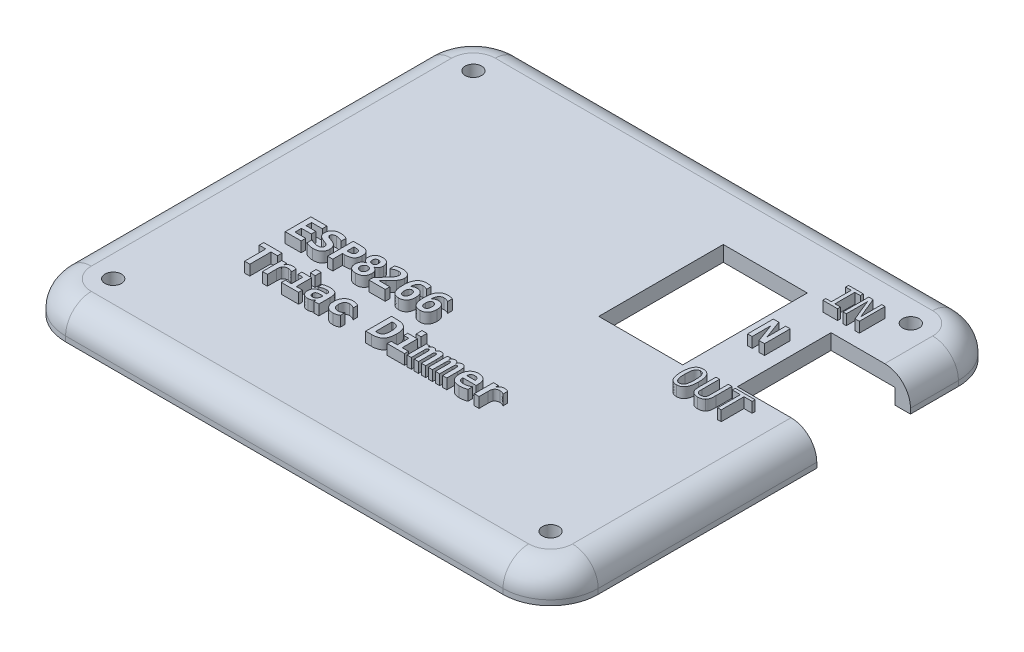
from build123d import *

# Parameters (mm, degrees)
BOSS_EXTRUDE1_DEPTH = 3
BOSS_EXTRUDE2_START = -3
BOSS_EXTRUDE2_DEPTH = 3
SKETCH1_8_R         = 1.6
CUT_EXTRUDE3_DEPTH  = 128.403394774
SKETCH2_W           = 18.2
SKETCH2_H           = 6
CUT_EXTRUDE4_DEPTH  = 15.43
CUT_EXTRUDE5_REACH  = 129.509
SKETCH3_W           = 16.32
SKETCH3_H           = 24.2
FILLET1_R           = 5
SKETCH4_W           = 0.949367088
SKETCH4_H           = 1.139240506
BOSS_EXTRUDE3_DEPTH = 2


with BuildPart() as part:
    # Sketch1 → Boss-Extrude1 (new body)
    with BuildSketch(Plane(origin=(0, 0, 0), x_dir=(1, 0, 0), z_dir=(0, 1, 0))):
        with BuildLine():
            Line((-3, 6.25), (-88, 6.25))
            ThreePointArc((-88, 6.25), (-94.540737726, 3.540737726), (-97.25, -3))
            Line((-97.25, -3), (-97.25, -73))
            ThreePointArc((-97.25, -73), (-94.540737726, -79.540737726), (-88, -82.25))
            Line((-88, -82.25), (-3, -82.25))
            ThreePointArc((-3, -82.25), (3.540737726, -79.540737726), (6.25, -73))
            Line((6.25, -73), (6.25, -3))
            ThreePointArc((6.25, -3), (3.540737726, 3.540737726), (-3, 6.25))
        make_face()
    extrude(amount=BOSS_EXTRUDE1_DEPTH)

    # Sketch1<7> → Boss-Extrude2 (add)
    with BuildSketch(Plane(origin=(0, 0, 0), x_dir=(1, 0, 0), z_dir=(0, 1, 0)).offset(BOSS_EXTRUDE2_START)):
        with BuildLine():
            ThreePointArc((6.25, -3), (3.540737726, 3.540737726), (-3, 6.25))
            Line((-3, 6.25), (-88, 6.25))
            ThreePointArc((-88, 6.25), (-94.540737726, 3.540737726), (-97.25, -3))
            Line((-97.25, -3), (-97.25, -73))
            ThreePointArc((-97.25, -73), (-94.540737726, -79.540737726), (-88, -82.25))
            Line((-88, -82.25), (-3, -82.25))
            ThreePointArc((-3, -82.25), (3.540737726, -79.540737726), (6.25, -73))
            Line((6.25, -73), (6.25, -3))
        make_face()
        with BuildLine():
            Line((-88, 3.25), (-3, 3.25))
            ThreePointArc((-3, 3.25), (1.419417382, 1.419417382), (3.25, -3))
            Line((3.25, -3), (3.25, -73))
            ThreePointArc((3.25, -73), (1.419417382, -77.419417382), (-3, -79.25))
            Line((-3, -79.25), (-88, -79.25))
            ThreePointArc((-88, -79.25), (-92.419417382, -77.419417382), (-94.25, -73))
            Line((-94.25, -73), (-94.25, -3))
            ThreePointArc((-94.25, -3), (-92.419417382, 1.419417382), (-88, 3.25))
        make_face(mode=Mode.SUBTRACT)
    extrude(amount=BOSS_EXTRUDE2_DEPTH)

    # Sketch1<8> → Cut-Extrude3 (cut, through all)
    with BuildSketch(Plane(origin=(0, 0, 0), x_dir=(1, 0, 0), z_dir=(0, 1, 0))):
        with Locations((-3, -3)):
            Circle(SKETCH1_8_R)
        with Locations((-88, -3)):
            Circle(SKETCH1_8_R)
        with Locations((-88, -73)):
            Circle(SKETCH1_8_R)
        with Locations((-3, -73)):
            Circle(SKETCH1_8_R)
    extrude(amount=CUT_EXTRUDE3_DEPTH, mode=Mode.SUBTRACT)

    # Sketch2 → Cut-Extrude4 (cut)
    with BuildSketch(Plane(origin=(6.25, 0, 0), x_dir=(0, 0, -1), z_dir=(1, 0, 0))):
        with Locations((-21.42, 0)):
            Rectangle(SKETCH2_W, SKETCH2_H)
    extrude(amount=-CUT_EXTRUDE4_DEPTH, mode=Mode.SUBTRACT)

    # Sketch3 → Cut-Extrude5 (cut, up to next)
    with BuildSketch(Plane(origin=(0, 3, 0), x_dir=(1, 0, 0), z_dir=(0, 1, 0)), mode=Mode.PRIVATE) as cut_extrude5_sk1:
        with Locations((-26.33, -20.05)):
            Rectangle(SKETCH3_W, SKETCH3_H)
    cut_extrude5_tool1 = extrude(cut_extrude5_sk1.sketch, amount=-CUT_EXTRUDE5_REACH, mode=Mode.PRIVATE) & part.part
    add(cut_extrude5_tool1.solids().sort_by_distance((-26.33, 3, 20.05))[0], mode=Mode.SUBTRACT)

    # Fillet1
    fillet1_edges = [part.edges().sort_by_distance(p)[0] for p in [
        (6.25, 3, 51.76),
        (3.540737726, 3, 79.540737726),
        (-45.5, 3, 82.25),
        (-94.540737726, 3, 79.540737726),
        (-97.25, 3, 38),
        (-94.540737726, 3, -3.540737726),
        (-45.5, 3, -6.25),
        (3.540737726, 3, -3.540737726),
        (6.25, 3, 7.66),
    ]]
    fillet(fillet1_edges, radius=FILLET1_R)

    # Sketch4 → Boss-Extrude3 (add)
    # profile 1 of 26: a face of its own
    with BuildSketch(Plane(origin=(0, 3, 0), x_dir=(1, 0, 0), z_dir=(0, 1, 0))):
        Polygon((-13.428218442, -4.659159356), (-10.580117176, -4.659159356), (-10.580117176, -5.22877961), (-11.656066543, -5.22877961), (-11.656066543, -9.089539103), (-10.580117176, -9.089539103), (-10.580117176, -9.659159356), (-13.428218442, -9.659159356), (-13.428218442, -9.089539103), (-12.352269075, -9.089539103), (-12.352269075, -5.22877961), (-13.428218442, -5.22877961), align=None)
    # profile 2 of 26: a face of its own
    with BuildSketch(Plane(origin=(0, 3, 0), x_dir=(1, 0, 0), z_dir=(0, 1, 0))):
        Polygon((-9.504167809, -4.659159356), (-8.666549138, -4.659159356), (-6.972522239, -8.775061255), (-6.972522239, -4.659159356), (-6.339610847, -4.659159356), (-6.339610847, -9.659159356), (-7.177229518, -9.659159356), (-8.871256416, -5.543257458), (-8.871256416, -9.659159356), (-9.504167809, -9.659159356), align=None)
    # profile 3 of 26: a face of its own
    with BuildSketch(Plane(origin=(0, 3, 0), x_dir=(1, 0, 0), z_dir=(0, 1, 0))):
        Polygon((-15.082718966, -17.63689814), (-14.013692068, -17.63689814), (-12.677655675, -21.270205102), (-12.677655675, -17.63689814), (-11.791579726, -17.63689814), (-11.791579726, -22.63689814), (-12.85467308, -22.63689814), (-14.196643017, -19.003591178), (-14.196643017, -22.63689814), (-15.082718966, -22.63689814), align=None)
    # profile 4 of 26: a face of its own
    with BuildSketch(Plane(origin=(0, 3, 0), x_dir=(1, 0, 0), z_dir=(0, 1, 0))):
        with BuildLine():
            add(Edge.make_bspline(
                [(-11.758191824, -35.490827692), (-11.759622218, -35.597656263), (-11.762388206, -35.804233209), (-11.780684303, -36.103672424), (-11.813114592, -36.381976842), (-11.858037323, -36.639716295), (-11.916071398, -36.876768014), (-11.986535042, -37.093591988), (-12.071663909, -37.2887891), (-12.168319644, -37.464058751), (-12.28001658, -37.61746217), (-12.403998551, -37.751677734), (-12.542788397, -37.864639762), (-12.695841695, -37.956337461), (-12.86227476, -38.027682168), (-13.041909318, -38.079237219), (-13.235216436, -38.110399547), (-13.368700346, -38.113722359), (-13.437384862, -38.115432122)],
                knots=[0, 0, 0, 0, 1.452364686, 2.808472085, 4.076445079, 5.259746991, 6.362994141, 7.391880962, 8.355208161, 9.254082442, 10.107463965, 10.928715412, 11.731528038, 12.531621658, 13.346637651, 14.186305721, 15.066758585, 16, 16, 16, 16], degree=3))
            add(Edge.make_bspline(
                [(-13.437384862, -38.115432122), (-13.506077734, -38.113753124), (-13.639577885, -38.110490099), (-13.832680486, -38.07891995), (-14.012638225, -38.028903632), (-14.178763971, -37.957557778), (-14.330893749, -37.865322678), (-14.469695734, -37.753393415), (-14.59522059, -37.621030739), (-14.705097644, -37.466543707), (-14.802417157, -37.292532003), (-14.884718494, -37.097032095), (-14.956001277, -36.88150577), (-15.014112433, -36.644431085), (-15.057321802, -36.385810333), (-15.09029147, -36.106328569), (-15.108361675, -35.805543661), (-15.11117156, -35.597983558), (-15.112622204, -35.490827692)],
                knots=[0, 0, 0, 0, 0.933306678, 1.813821114, 2.652315061, 3.467388049, 4.263700011, 5.063749159, 5.884862354, 6.735675164, 7.634612305, 8.590334636, 9.615038604, 10.718362906, 11.905391446, 13.177904503, 14.543052915, 16, 16, 16, 16], degree=3))
            add(Edge.make_bspline(
                [(-15.112622204, -35.490827692), (-15.111193257, -35.383669225), (-15.108429784, -35.176433084), (-15.090109006, -34.876011233), (-15.057793641, -34.597027178), (-15.012740751, -34.338985822), (-14.954841488, -34.10187786), (-14.883992126, -33.885364825), (-14.800364364, -33.689655247), (-14.703397901, -33.514679482), (-14.591857761, -33.361151878), (-14.46746673, -33.227097172), (-14.329378842, -33.112927056), (-14.176124513, -33.021694764), (-14.010303672, -32.949759803), (-13.83116837, -32.898638916), (-13.638581375, -32.867263109), (-13.505744231, -32.863964872), (-13.437384862, -32.862267565)],
                knots=[0, 0, 0, 0, 1.456714132, 2.817171865, 4.089481458, 5.272676908, 6.375824797, 7.404619048, 8.366075497, 9.264868905, 10.118173648, 10.939351207, 11.744925834, 12.544947469, 13.355777074, 14.195369598, 15.071318513, 16, 16, 16, 16], degree=3))
            add(Edge.make_bspline(
                [(-13.437384862, -32.862267565), (-13.368700006, -32.863976913), (-13.235215435, -32.867298919), (-13.041912984, -32.898466943), (-12.862261857, -32.950001767), (-12.695888013, -33.02141877), (-12.542438946, -33.112959851), (-12.404327951, -33.227086355), (-12.279963803, -33.361161995), (-12.168334855, -33.514648408), (-12.071659329, -33.689894027), (-11.986536781, -33.885098292), (-11.916069302, -34.101919909), (-11.858044503, -34.338973318), (-11.813028967, -34.597030907), (-11.780702487, -34.876010132), (-11.76238495, -35.17643339), (-11.759621012, -35.38366933), (-11.758191824, -35.490827692)],
                knots=[0, 0, 0, 0, 0.932295203, 1.811855378, 2.65067211, 3.46486176, 4.264144166, 5.068974434, 5.889393217, 6.741909498, 7.639872411, 8.602222896, 9.63006653, 10.7321951, 11.914297264, 13.185431231, 14.544631887, 16, 16, 16, 16], degree=3))
        make_face()
        with BuildLine():
            add(Edge.make_bspline(
                [(-12.454394356, -35.490827692), (-12.455333041, -35.401821408), (-12.457141478, -35.230345044), (-12.465870174, -34.982520296), (-12.485427016, -34.754721914), (-12.508769288, -34.546243779), (-12.542033492, -34.358326403), (-12.578899047, -34.189148861), (-12.626889287, -34.040711166), (-12.679745899, -33.90981703), (-12.742300388, -33.796713208), (-12.814321172, -33.699425181), (-12.894759139, -33.61643139), (-12.984621416, -33.547715961), (-13.08544112, -33.496252818), (-13.194488148, -33.458369497), (-13.313244347, -33.436555808), (-13.395101722, -33.433477768), (-13.437384862, -33.431887818)],
                knots=[0, 0, 0, 0, 1.671142903, 3.219564919, 4.653991277, 5.96280351, 7.156267779, 8.235683934, 9.210366128, 10.081550684, 10.882221414, 11.629830313, 12.347563971, 13.045658125, 13.74320342, 14.463440776, 15.206295725, 16, 16, 16, 16], degree=3))
            add(Edge.make_bspline(
                [(-13.437384862, -33.431887818), (-13.479331739, -33.433514026), (-13.560846045, -33.436674195), (-13.678734415, -33.458052649), (-13.786694384, -33.496420874), (-13.886487691, -33.548270864), (-13.976942162, -33.61609321), (-14.057530047, -33.699170308), (-14.128393563, -33.79704519), (-14.191055071, -33.909791977), (-14.244226178, -34.040526239), (-14.290297213, -34.189500845), (-14.329287463, -34.358126827), (-14.361798, -34.546288938), (-14.385830657, -34.754654877), (-14.4032263, -34.982608984), (-14.414156394, -35.230305838), (-14.415646357, -35.401812738), (-14.416419672, -35.490827692)],
                knots=[0, 0, 0, 0, 0.788650294, 1.532564173, 2.242124014, 2.935170969, 3.639214992, 4.357971771, 5.102969133, 5.90478121, 6.777207629, 7.751408236, 8.833765737, 10.028931275, 11.339609203, 12.775585563, 14.326474903, 16, 16, 16, 16], degree=3))
            add(Edge.make_bspline(
                [(-14.416419672, -35.490827692), (-14.415635433, -35.579512394), (-14.414121722, -35.75068845), (-14.403324685, -35.997406164), (-14.385711105, -36.224683132), (-14.361810603, -36.432401973), (-14.329277237, -36.620556689), (-14.290323035, -36.78920359), (-14.244145531, -36.938112096), (-14.191420671, -37.068790149), (-14.127709293, -37.180849773), (-14.058239707, -37.279459039), (-13.9765363, -37.3615498), (-13.88654437, -37.429480698), (-13.786678928, -37.481264667), (-13.678738795, -37.519651046), (-13.56084485, -37.541024399), (-13.479331333, -37.544185289), (-13.437384862, -37.545811869)],
                knots=[0, 0, 0, 0, 1.66976754, 3.22292585, 4.648627645, 5.961223111, 7.15813719, 8.242078193, 9.217704068, 10.091406857, 10.888976684, 11.64008127, 12.355460792, 13.06053484, 13.754595731, 14.465193667, 15.210195901, 16, 16, 16, 16], degree=3))
            add(Edge.make_bspline(
                [(-13.437384862, -37.545811869), (-13.395058563, -37.544799404), (-13.313037716, -37.542837427), (-13.194882575, -37.518553886), (-13.084891627, -37.48308944), (-12.98522614, -37.42959228), (-12.894749061, -37.362444321), (-12.814017161, -37.280173736), (-12.742642656, -37.183095368), (-12.679445424, -37.070691328), (-12.626949837, -36.939921073), (-12.578879818, -36.791528334), (-12.542040664, -36.622336615), (-12.50876195, -36.434424166), (-12.485487772, -36.22626891), (-12.465821138, -35.998809744), (-12.457152056, -35.751309466), (-12.455336655, -35.579833677), (-12.454394356, -35.490827692)],
                knots=[0, 0, 0, 0, 0.794236778, 1.539089772, 2.258140023, 2.959351764, 3.654515619, 4.368637508, 5.117089343, 5.913257047, 6.785423871, 7.761205029, 8.841838236, 10.036648147, 11.346936078, 12.776804992, 14.326972867, 16, 16, 16, 16], degree=3))
        make_face(mode=Mode.SUBTRACT)
    # profile 5 of 26: a face of its own
    with BuildSketch(Plane(origin=(0, 3, 0), x_dir=(1, 0, 0), z_dir=(0, 1, 0))):
        with BuildLine():
            Line((-10.872115875, -36.07627073), (-10.872115875, -32.988849843))
            Line((-10.872115875, -32.988849843), (-10.175913343, -32.988849843))
            Line((-10.175913343, -32.988849843), (-10.175913343, -36.384815033))
            add(Edge.make_bspline(
                [(-10.175913343, -36.384815033), (-10.17585899, -36.441515782), (-10.1757588, -36.546033957), (-10.17176021, -36.689796136), (-10.166011308, -36.807174416), (-10.15907111, -36.901426318), (-10.1463939, -36.977606947), (-10.132023663, -37.042227283), (-10.113938299, -37.098368524), (-10.096890958, -37.130977948), (-10.088888027, -37.146286552)],
                knots=[0, 0, 0, 0, 1.760312223, 3.244835822, 4.464252719, 5.409352176, 6.176575992, 6.859282312, 7.464486234, 8, 8, 8, 8], degree=3))
            add(Edge.make_bspline(
                [(-10.088888027, -37.146286552), (-10.071149611, -37.177985664), (-10.036241876, -37.240366895), (-9.96580415, -37.321238087), (-9.885655494, -37.391208719), (-9.792881504, -37.447985513), (-9.690079852, -37.492645558), (-9.576259586, -37.522378115), (-9.453452665, -37.543354479), (-9.367730022, -37.544974996), (-9.323460811, -37.545811869)],
                knots=[0, 0, 0, 0, 0.954010915, 1.877414575, 2.806469249, 3.745682233, 4.729080501, 5.74595015, 6.835955087, 8, 8, 8, 8], degree=3))
            add(Edge.make_bspline(
                [(-9.323460811, -37.545811869), (-9.278523199, -37.545027076), (-9.192123868, -37.543518194), (-9.068438674, -37.522125586), (-8.954599033, -37.49330957), (-8.852646085, -37.447412491), (-8.760220231, -37.391305624), (-8.680083474, -37.320960218), (-8.608770306, -37.240223527), (-8.572526235, -37.177972501), (-8.5540779, -37.146286552)],
                knots=[0, 0, 0, 0, 1.177766856, 2.264434238, 3.2865362, 4.251067392, 5.187404541, 6.113614484, 7.039824427, 8, 8, 8, 8], degree=3))
            add(Edge.make_bspline(
                [(-8.5540779, -37.146286552), (-8.54606551, -37.130979678), (-8.528998023, -37.09837394), (-8.511184173, -37.042508023), (-8.496068828, -36.978403496), (-8.485700322, -36.902554771), (-8.476262366, -36.809261319), (-8.471472876, -36.693064522), (-8.467118037, -36.550988348), (-8.467075619, -36.447782321), (-8.467052584, -36.391737502)],
                knots=[0, 0, 0, 0, 0.540372588, 1.151067645, 1.829909672, 2.60250885, 3.546855992, 4.767023055, 6.244369879, 8, 8, 8, 8], degree=3))
            Line((-8.467052584, -36.391737502), (-8.467052584, -32.988849843))
            Line((-8.467052584, -32.988849843), (-7.770850052, -32.988849843))
            Line((-7.770850052, -32.988849843), (-7.770850052, -36.07627073))
            add(Edge.make_bspline(
                [(-7.770850052, -36.07627073), (-7.770812649, -36.138579325), (-7.770740599, -36.258603799), (-7.776520056, -36.431323749), (-7.782363932, -36.590340806), (-7.793964181, -36.734996744), (-7.805673149, -36.866137414), (-7.823190607, -36.982721862), (-7.840773679, -37.086082835), (-7.87117535, -37.202994549), (-7.916543738, -37.334810275), (-7.991281125, -37.477460629), (-8.080454526, -37.608068785), (-8.154318485, -37.682010517), (-8.191142773, -37.718873578)],
                knots=[0, 0, 0, 0, 1.283404541, 2.472210375, 3.559714486, 4.560694835, 5.461364716, 6.27090519, 6.988795868, 7.619572975, 8.757852302, 9.851191884, 10.928728842, 12, 12, 12, 12], degree=3))
            add(Edge.make_bspline(
                [(-8.191142773, -37.718873578), (-8.228003222, -37.751120739), (-8.301238848, -37.815190525), (-8.424166704, -37.894952925), (-8.55298931, -37.964718652), (-8.690787326, -38.020190395), (-8.83627507, -38.06276036), (-8.990175315, -38.09305155), (-9.152867188, -38.112512975), (-9.264397526, -38.114443835), (-9.321482963, -38.115432122)],
                knots=[0, 0, 0, 0, 0.956794456, 1.900992632, 2.858655678, 3.818898131, 4.800230862, 5.819405246, 6.883889297, 8, 8, 8, 8], degree=3))
            add(Edge.make_bspline(
                [(-9.321482963, -38.115432122), (-9.3779098, -38.114437962), (-9.488454493, -38.112490324), (-9.65014163, -38.09295717), (-9.803726079, -38.062770139), (-9.949207646, -38.020181086), (-10.087024318, -37.964745863), (-10.216021021, -37.894722666), (-10.339844125, -37.81497228), (-10.414274646, -37.751097136), (-10.451823153, -37.718873578)],
                knots=[0, 0, 0, 0, 1.103771314, 2.162376442, 3.182057108, 4.163877321, 5.124596781, 6.082735552, 7.032783649, 8, 8, 8, 8], degree=3))
            add(Edge.make_bspline(
                [(-10.451823153, -37.718873578), (-10.48830434, -37.68233272), (-10.561486922, -37.609030438), (-10.65047217, -37.478641447), (-10.724347855, -37.334257704), (-10.770802456, -37.200783183), (-10.80114475, -37.082105025), (-10.81888394, -36.977785958), (-10.835818966, -36.860449817), (-10.849782853, -36.729516715), (-10.858685757, -36.585299588), (-10.867358534, -36.427761436), (-10.870469761, -36.256594895), (-10.871553164, -36.137913104), (-10.872115875, -36.07627073)],
                knots=[0, 0, 0, 0, 1.062188998, 2.13078957, 3.236745723, 4.39705828, 5.03472644, 5.759650255, 6.576309159, 7.478108119, 8.472313151, 9.5538789, 10.729504235, 12, 12, 12, 12], degree=3))
        make_face()
    # profile 6 of 26: a face of its own
    with BuildSketch(Plane(origin=(0, 3, 0), x_dir=(1, 0, 0), z_dir=(0, 1, 0))):
        Polygon((-7.13793866, -32.988849843), (-3.277179166, -32.988849843), (-3.277179166, -33.558470097), (-4.859457647, -33.558470097), (-4.859457647, -37.988849843), (-5.555660179, -37.988849843), (-5.555660179, -33.558470097), (-7.13793866, -33.558470097), align=None)
    # profile 7 of 26: a face of its own
    with BuildSketch(Plane(origin=(0, 3, 0), x_dir=(1, 0, 0), z_dir=(0, 1, 0))):
        Polygon((-74.105316196, -50.365780619), (-77.206582019, -50.365780619), (-77.206582019, -45.365780619), (-74.105316196, -45.365780619), (-74.105316196, -46.251856568), (-76.193923791, -46.251856568), (-76.193923791, -47.327805935), (-74.295189614, -47.327805935), (-74.295189614, -48.213881885), (-76.193923791, -48.213881885), (-76.193923791, -49.47970467), (-74.105316196, -49.47970467), align=None)
    # profile 8 of 26: a face of its own
    with BuildSketch(Plane(origin=(0, 3, 0), x_dir=(1, 0, 0), z_dir=(0, 1, 0))):
        with BuildLine():
            add(Edge.make_bspline(
                [(-71.943528222, -48.16146891), (-72.003376761, -48.137850272), (-72.118958696, -48.092236996), (-72.283271569, -48.01901079), (-72.432388842, -47.945100859), (-72.567210276, -47.870977006), (-72.686252109, -47.7951027), (-72.791523097, -47.719506981), (-72.87958193, -47.640624401), (-72.955738199, -47.561767953), (-73.019560573, -47.477845183), (-73.072399441, -47.387361043), (-73.118619531, -47.291058463), (-73.154841435, -47.187425082), (-73.183590489, -47.077280678), (-73.203913827, -46.960516841), (-73.217446022, -46.836957622), (-73.218630818, -46.752290226), (-73.219240247, -46.70873948)],
                knots=[0, 0, 0, 0, 1.472544612, 2.843838086, 4.115936908, 5.281154858, 6.36328656, 7.345710787, 8.243605201, 9.065497945, 9.851706732, 10.650094388, 11.460091446, 12.292958612, 13.158571906, 14.062878692, 15.003594274, 16, 16, 16, 16], degree=3))
            add(Edge.make_bspline(
                [(-73.219240247, -46.70873948), (-73.217982366, -46.652964661), (-73.215531781, -46.544304953), (-73.194398295, -46.385948007), (-73.159589785, -46.237062786), (-73.112913395, -46.096463009), (-73.049465496, -45.966393797), (-72.97432424, -45.844215438), (-72.883354704, -45.73253683), (-72.780626102, -45.629394893), (-72.66543814, -45.537357577), (-72.539370237, -45.456630729), (-72.402206059, -45.390016198), (-72.255869541, -45.33378421), (-72.098639955, -45.291761655), (-71.93127737, -45.26153526), (-71.753780407, -45.242111257), (-71.632069196, -45.240185124), (-71.56971493, -45.23919834)],
                knots=[0, 0, 0, 0, 1.070160926, 2.084872299, 3.059397942, 4.001764525, 4.921451232, 5.830852006, 6.748796056, 7.679343452, 8.620009395, 9.573041232, 10.546395508, 11.541649412, 12.57765683, 13.664740693, 14.803615719, 16, 16, 16, 16], degree=3))
            add(Edge.make_bspline(
                [(-71.56971493, -45.23919834), (-71.511671927, -45.240192455), (-71.395070519, -45.242189511), (-71.220295235, -45.257093177), (-71.045850315, -45.283492993), (-70.87144842, -45.317830386), (-70.697445218, -45.362363529), (-70.523935869, -45.417161725), (-70.351181061, -45.480918998), (-70.238053013, -45.530676843), (-70.181265563, -45.555654037)],
                knots=[0, 0, 0, 0, 0.970752235, 1.950124402, 2.931016252, 3.920378254, 4.921954688, 5.933331708, 6.962584227, 8, 8, 8, 8], degree=3))
            Line((-70.181265563, -45.555654037), (-70.181265563, -46.505021125))
            add(Edge.make_bspline(
                [(-70.181265563, -46.505021125), (-70.235711377, -46.475489978), (-70.343569837, -46.416988069), (-70.508427695, -46.339305097), (-70.675789954, -46.275401945), (-70.843204917, -46.220524755), (-71.011125264, -46.178275035), (-71.178142075, -46.146978739), (-71.344492491, -46.128834696), (-71.45528754, -46.12645672), (-71.510379487, -46.12527429)],
                knots=[0, 0, 0, 0, 1.063534704, 2.106887689, 3.126570203, 4.137986078, 5.130598741, 6.097638126, 7.054065851, 8, 8, 8, 8], degree=3))
            add(Edge.make_bspline(
                [(-71.510379487, -46.12527429), (-71.568145563, -46.126993298), (-71.677017919, -46.13023313), (-71.830564607, -46.15373656), (-71.962564504, -46.197153503), (-72.073644404, -46.256328917), (-72.163189226, -46.332002838), (-72.22430764, -46.426687178), (-72.264578102, -46.534539479), (-72.268063551, -46.612101476), (-72.269873158, -46.652370809)],
                knots=[0, 0, 0, 0, 1.329012981, 2.504805326, 3.560091569, 4.510406224, 5.386553044, 6.223755255, 7.077793318, 8, 8, 8, 8], degree=3))
            add(Edge.make_bspline(
                [(-72.269873158, -46.652370809), (-72.268354889, -46.683915452), (-72.265382481, -46.745672344), (-72.236240549, -46.833458894), (-72.189868771, -46.912786967), (-72.134820845, -46.970000571), (-72.079975704, -47.012977162), (-72.027725058, -47.045928671), (-71.96531991, -47.079600358), (-71.893691431, -47.115219276), (-71.8111879, -47.150375576), (-71.719183973, -47.186954583), (-71.617275035, -47.224501051), (-71.545707501, -47.248853745), (-71.508401639, -47.261548024)],
                knots=[0, 0, 0, 0, 1.079734148, 2.113862046, 3.13847523, 4.211071348, 4.815442741, 5.52792591, 6.328014387, 7.248985387, 8.272660996, 9.40517486, 10.647400794, 12, 12, 12, 12], degree=3))
            Line((-71.508401639, -47.261548024), (-71.058441196, -47.425709416))
            add(Edge.make_bspline(
                [(-71.058441196, -47.425709416), (-71.011415535, -47.444649704), (-70.919251694, -47.481770069), (-70.787880554, -47.544740079), (-70.666804012, -47.613591662), (-70.554445789, -47.685645429), (-70.451697281, -47.76232994), (-70.358936811, -47.844184534), (-70.275436122, -47.930089448), (-70.201884516, -48.021673245), (-70.13735228, -48.118433267), (-70.079933446, -48.220333656), (-70.034814478, -48.329928835), (-69.993719974, -48.443856143), (-69.965293361, -48.564802153), (-69.94298319, -48.691176268), (-69.930092586, -48.823779018), (-69.928773555, -48.914342831), (-69.928101006, -48.960519543)],
                knots=[0, 0, 0, 0, 1.186193711, 2.32477683, 3.405991612, 4.443761942, 5.446596544, 6.403053151, 7.335950578, 8.246738673, 9.147474843, 10.055580198, 10.978344107, 11.91759866, 12.886756457, 13.881039404, 14.919583559, 16, 16, 16, 16], degree=3))
            add(Edge.make_bspline(
                [(-69.928101006, -48.960519543), (-69.929359995, -49.022879074), (-69.931798882, -49.143680693), (-69.952569065, -49.318902646), (-69.988072005, -49.481855166), (-70.037436147, -49.633136498), (-70.1006474, -49.772433626), (-70.178425906, -49.899553499), (-70.270863232, -50.013917481), (-70.377898446, -50.115513985), (-70.498667318, -50.205307057), (-70.634076334, -50.282265906), (-70.78355597, -50.347782718), (-70.947319909, -50.400718437), (-71.125306566, -50.442159034), (-71.317738698, -50.471266964), (-71.524541322, -50.489224352), (-71.667250556, -50.491295492), (-71.740798791, -50.492362897)],
                knots=[0, 0, 0, 0, 1.099954599, 2.130809751, 3.10732321, 4.03793639, 4.933203873, 5.800003864, 6.660164163, 7.519911467, 8.396952816, 9.30876676, 10.261861239, 11.271565336, 12.340880584, 13.482571661, 14.702589841, 16, 16, 16, 16], degree=3))
            add(Edge.make_bspline(
                [(-71.740798791, -50.492362897), (-71.80346943, -50.49120636), (-71.928731747, -50.488894741), (-72.117085636, -50.470549599), (-72.305146684, -50.439537186), (-72.493218165, -50.398394612), (-72.679446027, -50.344695419), (-72.863183301, -50.2796302), (-73.043767156, -50.202398838), (-73.160563821, -50.142638514), (-73.219240247, -50.112616062)],
                knots=[0, 0, 0, 0, 0.975522958, 1.94981683, 2.942811633, 3.941386662, 4.9451699, 5.957990058, 6.97413299, 8, 8, 8, 8], degree=3))
            Line((-73.219240247, -50.112616062), (-73.219240247, -49.099957834))
            add(Edge.make_bspline(
                [(-73.219240247, -49.099957834), (-73.152099262, -49.14060377), (-73.020746772, -49.220122187), (-72.820954238, -49.323862173), (-72.624463102, -49.41139807), (-72.431188467, -49.483439563), (-72.239064794, -49.538405358), (-72.048492798, -49.576326964), (-71.859163846, -49.601789717), (-71.733297281, -49.604791387), (-71.670585184, -49.606286948)],
                knots=[0, 0, 0, 0, 1.140674724, 2.23157978, 3.269846868, 4.265911793, 5.227552685, 6.171066883, 7.088747422, 8, 8, 8, 8], degree=3))
            add(Edge.make_bspline(
                [(-71.670585184, -49.606286948), (-71.611103338, -49.604699463), (-71.498172291, -49.601685496), (-71.339267507, -49.571011346), (-71.201105973, -49.520804532), (-71.101853237, -49.461595522), (-71.036312543, -49.40366995), (-70.993275187, -49.357333219), (-70.957692786, -49.306126673), (-70.927227242, -49.251900263), (-70.906052358, -49.192104903), (-70.888964717, -49.12942895), (-70.878861568, -49.062372355), (-70.877939937, -49.016591938), (-70.877468095, -48.993154037)],
                knots=[0, 0, 0, 0, 1.887026324, 3.582670583, 5.112836553, 6.536433101, 7.218820099, 7.885615045, 8.539048673, 9.194825565, 9.853935524, 10.547075708, 11.256155824, 12, 12, 12, 12], degree=3))
            add(Edge.make_bspline(
                [(-70.877468095, -48.993154037), (-70.879079786, -48.957695885), (-70.882246177, -48.888033406), (-70.910419433, -48.787183712), (-70.955005751, -48.693034094), (-71.019070372, -48.607138828), (-71.098582028, -48.528971365), (-71.194380336, -48.459245801), (-71.30540385, -48.397395386), (-71.387608131, -48.366427452), (-71.430276639, -48.350353404)],
                knots=[0, 0, 0, 0, 0.935354156, 1.83763357, 2.745446436, 3.674083785, 4.653465839, 5.681385158, 6.796512345, 8, 8, 8, 8], degree=3))
            Line((-71.430276639, -48.350353404), (-71.943528222, -48.16146891))
        make_face()
    # profile 9 of 26: a face of its own
    with BuildSketch(Plane(origin=(0, 3, 0), x_dir=(1, 0, 0), z_dir=(0, 1, 0))):
        with BuildLine():
            Line((-68.978733918, -45.365780619), (-67.602151639, -45.365780619))
            add(Edge.make_bspline(
                [(-67.602151639, -45.365780619), (-67.520043673, -45.366927648), (-67.361908189, -45.369136762), (-67.133347782, -45.385724026), (-66.922980146, -45.414185692), (-66.729494431, -45.452761965), (-66.554740813, -45.505386406), (-66.396773619, -45.567048655), (-66.256993626, -45.641255144), (-66.134823874, -45.728228219), (-66.027837137, -45.827525378), (-65.936513912, -45.941436187), (-65.85875853, -46.069389889), (-65.79535364, -46.211605949), (-65.747674126, -46.36827468), (-65.711737357, -46.538252969), (-65.691341948, -46.722746442), (-65.688871284, -46.850435703), (-65.687594677, -46.91641353)],
                knots=[0, 0, 0, 0, 1.383306804, 2.66417379, 3.858054963, 4.958163367, 5.984316454, 6.929007617, 7.811089103, 8.643294078, 9.448830205, 10.262424656, 11.094907567, 11.965018523, 12.878451642, 13.848975697, 14.888552489, 16, 16, 16, 16], degree=3))
            add(Edge.make_bspline(
                [(-65.687594677, -46.91641353), (-65.688871327, -46.982391311), (-65.691342072, -47.11008048), (-65.711736911, -47.294574589), (-65.74767564, -47.464550694), (-65.79534845, -47.621226895), (-65.858776585, -47.763417056), (-65.936450267, -47.891461784), (-66.028210118, -48.005220492), (-66.134159861, -48.105732196), (-66.257358467, -48.191444485), (-66.396952841, -48.265563382), (-66.554329127, -48.32897676), (-66.729727652, -48.379631283), (-66.922937597, -48.418777635), (-67.133360442, -48.44706249), (-67.361904627, -48.463701706), (-67.520042456, -48.465903312), (-67.602151639, -48.467046442)],
                knots=[0, 0, 0, 0, 1.111372457, 2.150879049, 3.121337566, 4.034709003, 4.904761202, 5.737187897, 6.550727408, 7.360009909, 8.18894664, 9.070968561, 10.017666859, 11.042171448, 12.142205564, 13.336006116, 14.616786607, 16, 16, 16, 16], degree=3))
            Line((-67.602151639, -48.467046442), (-67.96607569, -48.467046442))
            Line((-67.96607569, -48.467046442), (-67.96607569, -50.365780619))
            Line((-67.96607569, -50.365780619), (-68.978733918, -50.365780619))
            Line((-68.978733918, -50.365780619), (-68.978733918, -45.365780619))
        make_face()
        with BuildLine():
            Line((-67.96607569, -46.251856568), (-67.96607569, -47.580970492))
            Line((-67.96607569, -47.580970492), (-67.566550373, -47.580970492))
            add(Edge.make_bspline(
                [(-67.566550373, -47.580970492), (-67.52797048, -47.580707996), (-67.454037864, -47.58020496), (-67.347415283, -47.573162702), (-67.249621599, -47.561678934), (-67.16075794, -47.545007465), (-67.081103789, -47.524245202), (-67.009752147, -47.49997829), (-66.947766809, -47.469491267), (-66.893621079, -47.434267954), (-66.847356224, -47.392904713), (-66.807228892, -47.345196614), (-66.774902995, -47.289555183), (-66.746562589, -47.228269336), (-66.726853629, -47.159381827), (-66.710221593, -47.084563184), (-66.701959594, -47.002633632), (-66.700833902, -46.945764871), (-66.700252905, -46.91641353)],
                knots=[0, 0, 0, 0, 1.45714219, 2.792395862, 4.034205489, 5.174738149, 6.204679331, 7.142005871, 8.016337297, 8.807235476, 9.574549132, 10.352599179, 11.15130118, 11.998429701, 12.896556805, 13.851501495, 14.891108071, 16, 16, 16, 16], degree=3))
            add(Edge.make_bspline(
                [(-66.700252905, -46.91641353), (-66.700835245, -46.887062794), (-66.701963539, -46.830195202), (-66.710207447, -46.748257519), (-66.726900772, -46.673466422), (-66.746319821, -46.604774918), (-66.77517311, -46.544054377), (-66.807198941, -46.488606833), (-66.847362495, -46.440910272), (-66.893625063, -46.399564176), (-66.947742614, -46.36425589), (-67.009959198, -46.334085919), (-67.080868931, -46.308256592), (-67.160797361, -46.287929304), (-67.24960953, -46.271114537), (-67.347418887, -46.259674388), (-67.454036837, -46.252619242), (-67.527970128, -46.252118085), (-67.566550373, -46.251856568)],
                knots=[0, 0, 0, 0, 1.109385884, 2.149455551, 3.104825621, 4.003352794, 4.839520594, 5.638578376, 6.416975005, 7.18463046, 7.975880944, 8.85060184, 9.792556801, 10.82295677, 11.963997478, 13.206360269, 14.542208728, 16, 16, 16, 16], degree=3))
            Line((-67.566550373, -46.251856568), (-67.96607569, -46.251856568))
        make_face(mode=Mode.SUBTRACT)
    # profile 10 of 26: a face of its own
    with BuildSketch(Plane(origin=(0, 3, 0), x_dir=(1, 0, 0), z_dir=(0, 1, 0))):
        with BuildLine():
            add(Edge.make_bspline(
                [(-64.097404804, -47.716453087), (-64.127907579, -47.705012243), (-64.188105489, -47.682433481), (-64.273622724, -47.641900017), (-64.353680189, -47.597087359), (-64.428057893, -47.547475608), (-64.497443218, -47.49323405), (-64.561040626, -47.433702133), (-64.618267622, -47.369229346), (-64.67032673, -47.300724837), (-64.715423507, -47.227083613), (-64.756154135, -47.150449582), (-64.790372777, -47.069499359), (-64.816339868, -46.984050319), (-64.838426284, -46.895018403), (-64.854321434, -46.801850129), (-64.863117434, -46.704627449), (-64.86423895, -46.638543206), (-64.864809867, -46.604902454)],
                knots=[0, 0, 0, 0, 1.076132635, 2.123771882, 3.123601155, 4.105467961, 5.075174956, 6.030768975, 6.979696774, 7.92084017, 8.869955511, 9.829823754, 10.786720644, 11.76858745, 12.777807216, 13.816460519, 14.888450449, 16, 16, 16, 16], degree=3))
            add(Edge.make_bspline(
                [(-64.864809867, -46.604902454), (-64.863807545, -46.553418958), (-64.861853574, -46.453054754), (-64.842649257, -46.306647672), (-64.811092994, -46.168920085), (-64.76768056, -46.039049148), (-64.710738652, -45.917958327), (-64.642617328, -45.804293501), (-64.560494422, -45.699771658), (-64.466611938, -45.603976748), (-64.362033087, -45.518277798), (-64.248060184, -45.443304422), (-64.125138221, -45.379837689), (-63.992940142, -45.328864251), (-63.852486371, -45.28769356), (-63.702769878, -45.25955259), (-63.543997664, -45.242645026), (-63.43519831, -45.240366124), (-63.379445943, -45.23919834)],
                knots=[0, 0, 0, 0, 1.082408871, 2.110095691, 3.099046308, 4.0506149, 4.984257349, 5.908169238, 6.83187298, 7.773232567, 8.724017798, 9.670140054, 10.637640199, 11.627756744, 12.645856373, 13.711931633, 14.827518508, 16, 16, 16, 16], degree=3))
            add(Edge.make_bspline(
                [(-63.379445943, -45.23919834), (-63.323366662, -45.240377331), (-63.213914984, -45.242678404), (-63.05444598, -45.259402308), (-62.903868219, -45.288038448), (-62.76253939, -45.328465516), (-62.629810429, -45.379881479), (-62.506872782, -45.44329309), (-62.392903964, -45.518280823), (-62.288324023, -45.603975945), (-62.194441828, -45.699771868), (-62.112318846, -45.804293445), (-62.044197542, -45.917958342), (-61.987255628, -46.039049143), (-61.943843197, -46.168920086), (-61.912286933, -46.306647671), (-61.893082616, -46.453054754), (-61.891128645, -46.553418958), (-61.890126323, -46.604902454)],
                knots=[0, 0, 0, 0, 1.177412885, 2.297993349, 3.362262914, 4.391938092, 5.3803776, 6.346239014, 7.290758749, 8.239933562, 9.179698695, 10.101837888, 11.024184875, 11.956245941, 12.906202788, 13.893478342, 14.919424489, 16, 16, 16, 16], degree=3))
            add(Edge.make_bspline(
                [(-61.890126323, -46.604902454), (-61.890677403, -46.638218161), (-61.891765207, -46.703981722), (-61.900902192, -46.800427452), (-61.915176808, -46.893164227), (-61.937845996, -46.981357801), (-61.963646156, -47.06683604), (-61.997740465, -47.147473601), (-62.036410811, -47.224875001), (-62.096911745, -47.321530373), (-62.186466642, -47.433531758), (-62.317647176, -47.548416815), (-62.470237067, -47.645874105), (-62.584147396, -47.692491603), (-62.642697525, -47.716453087)],
                knots=[0, 0, 0, 0, 0.832719086, 1.643746362, 2.420074558, 3.175609417, 3.918452926, 4.650010913, 5.361328889, 6.079393871, 7.497726764, 8.928099342, 10.421037104, 12, 12, 12, 12], degree=3))
            add(Edge.make_bspline(
                [(-62.642697525, -47.716453087), (-62.608877612, -47.727799865), (-62.54229492, -47.750138744), (-62.447199581, -47.792125503), (-62.357525879, -47.839396835), (-62.273999643, -47.894333962), (-62.195956248, -47.955560396), (-62.123469062, -48.023022736), (-62.056755124, -48.096883948), (-61.995720963, -48.176476143), (-61.941414922, -48.261657626), (-61.893852485, -48.350944976), (-61.852943402, -48.443997582), (-61.820448156, -48.541763375), (-61.794496734, -48.643492934), (-61.777172161, -48.749740718), (-61.765919449, -48.859737923), (-61.764344016, -48.934449587), (-61.763544044, -48.972386632)],
                knots=[0, 0, 0, 0, 1.037093023, 2.041768847, 3.019737542, 3.98240566, 4.945264746, 5.901801768, 6.858915249, 7.836930943, 8.815698306, 9.793667002, 10.776932315, 11.768390871, 12.786924947, 13.827248314, 14.896721451, 16, 16, 16, 16], degree=3))
            add(Edge.make_bspline(
                [(-61.763544044, -48.972386632), (-61.764860883, -49.031451616), (-61.767421414, -49.146300696), (-61.78761206, -49.313387323), (-61.819821112, -49.470042767), (-61.865183173, -49.616778973), (-61.924933831, -49.752912147), (-61.997181476, -49.879166422), (-62.082706749, -49.995116259), (-62.182417315, -50.098897355), (-62.293101385, -50.192347413), (-62.415971213, -50.272563564), (-62.549239837, -50.341589622), (-62.694254342, -50.396117932), (-62.849594354, -50.440345889), (-63.0165848, -50.470050995), (-63.194386499, -50.489460294), (-63.316759762, -50.491379683), (-63.379445943, -50.492362897)],
                knots=[0, 0, 0, 0, 1.122315928, 2.182290457, 3.193541861, 4.158555338, 5.095585461, 6.013336507, 6.91803554, 7.826479768, 8.74256128, 9.665260267, 10.609551064, 11.589238326, 12.604731096, 13.675042411, 14.809031413, 16, 16, 16, 16], degree=3))
            add(Edge.make_bspline(
                [(-63.379445943, -50.492362897), (-63.441801838, -50.49137679), (-63.563516229, -50.489451975), (-63.74034526, -50.470089247), (-63.906619491, -50.440173275), (-64.06142849, -50.396348905), (-64.205928851, -50.3413383), (-64.338975606, -50.272591803), (-64.461832006, -50.192339978), (-64.572519615, -50.098899322), (-64.672229244, -49.995115736), (-64.757754768, -49.879166564), (-64.830002344, -49.752912108), (-64.889753021, -49.616778984), (-64.935115077, -49.470042763), (-64.96732413, -49.313387324), (-64.987514775, -49.146300695), (-64.990075307, -49.031451616), (-64.991392146, -48.972386632)],
                knots=[0, 0, 0, 0, 1.186523445, 2.316011639, 3.38179441, 4.398844528, 5.374178248, 6.319917199, 7.244031227, 8.16151763, 9.071355039, 9.977441508, 10.896600007, 11.835067149, 12.801560559, 13.814362807, 14.875962901, 16, 16, 16, 16], degree=3))
            add(Edge.make_bspline(
                [(-64.991392146, -48.972386632), (-64.990575703, -48.934124102), (-64.988974649, -48.859090801), (-64.978018538, -48.748320726), (-64.95923789, -48.641941884), (-64.933629057, -48.53974745), (-64.90068836, -48.441827093), (-64.860525389, -48.347933951), (-64.81144253, -48.25869258), (-64.756199727, -48.173521239), (-64.694270798, -48.093523859), (-64.625450616, -48.020404127), (-64.55234735, -47.9525369), (-64.472817213, -47.892025903), (-64.387182191, -47.838533631), (-64.295860759, -47.791110558), (-64.199196088, -47.749173532), (-64.131561655, -47.727432685), (-64.097404804, -47.716453087)],
                knots=[0, 0, 0, 0, 1.104697461, 2.16632559, 3.210011598, 4.221074325, 5.205260142, 6.190044038, 7.165353973, 8.142102452, 9.118758187, 10.081730211, 11.038236887, 11.995737435, 12.962230563, 13.949861857, 14.964635903, 16, 16, 16, 16], degree=3))
        make_face()
        with BuildLine():
            add(Edge.make_bspline(
                [(-63.379445943, -48.150590746), (-63.405842369, -48.151094303), (-63.45784072, -48.152086261), (-63.533802349, -48.161844622), (-63.605279156, -48.17936399), (-63.673813913, -48.200430365), (-63.737640254, -48.230751575), (-63.798662194, -48.265824662), (-63.854035024, -48.309557715), (-63.906806079, -48.357128248), (-63.95243499, -48.411808067), (-63.994190067, -48.46972269), (-64.028325373, -48.532677375), (-64.056003017, -48.60016952), (-64.079385283, -48.670629316), (-64.093346084, -48.746511357), (-64.104020752, -48.825722316), (-64.104880165, -48.880376983), (-64.105316196, -48.908106568)],
                knots=[0, 0, 0, 0, 1.071854805, 2.111448088, 3.101945961, 4.058845329, 5.017335708, 5.965673098, 6.910981253, 7.877387403, 8.846016882, 9.796996937, 10.77364356, 11.745875107, 12.757857451, 13.781901778, 14.874625925, 16, 16, 16, 16], degree=3))
            add(Edge.make_bspline(
                [(-64.105316196, -48.908106568), (-64.104919637, -48.936170646), (-64.104147175, -48.990836962), (-64.093117759, -49.070319572), (-64.079594444, -49.146295603), (-64.055736676, -49.217251474), (-64.028643643, -49.285330011), (-63.993845538, -49.348563964), (-63.952787269, -49.407291385), (-63.906743883, -49.461991787), (-63.854103653, -49.509732778), (-63.798319579, -49.55308433), (-63.738236716, -49.589930423), (-63.673304075, -49.618140389), (-63.605539934, -49.6412171), (-63.533756752, -49.658199801), (-63.45785277, -49.668115447), (-63.405846426, -49.6690856), (-63.379445943, -49.669578087)],
                knots=[0, 0, 0, 0, 1.135765661, 2.212370086, 3.246824352, 4.256150662, 5.238164988, 6.212248318, 7.171667688, 8.137754917, 9.101624651, 10.044451764, 10.997156607, 11.947612734, 12.90619536, 13.894093587, 14.93095837, 16, 16, 16, 16], degree=3))
            add(Edge.make_bspline(
                [(-63.379445943, -49.669578087), (-63.353045101, -49.669087646), (-63.301038049, -49.668121525), (-63.225139173, -49.658176801), (-63.152929485, -49.641201898), (-63.085005882, -49.617607645), (-63.02068979, -49.587496398), (-62.960141442, -49.550956937), (-62.903860799, -49.507031593), (-62.851098687, -49.457730276), (-62.804498013, -49.402453294), (-62.76180636, -49.343993737), (-62.727964251, -49.280286625), (-62.69829102, -49.213543625), (-62.677244639, -49.142246811), (-62.661310636, -49.067550631), (-62.650968813, -48.989156507), (-62.650075864, -48.935499629), (-62.649619994, -48.908106568)],
                knots=[0, 0, 0, 0, 1.068821033, 2.105471859, 3.093166233, 4.068511672, 5.012183675, 5.964691928, 6.926047917, 7.898831469, 8.88354364, 9.850445959, 10.824328288, 11.799033886, 12.804169767, 13.828017672, 14.891153446, 16, 16, 16, 16], degree=3))
            add(Edge.make_bspline(
                [(-62.649619994, -48.908106568), (-62.650097518, -48.88038645), (-62.651038714, -48.825750442), (-62.661134518, -48.746339175), (-62.677172758, -48.670963199), (-62.698569771, -48.599964589), (-62.726703707, -48.532695969), (-62.760772142, -48.469761234), (-62.802437114, -48.411464286), (-62.84916944, -48.357456147), (-62.901835706, -48.309511328), (-62.957275797, -48.265832214), (-63.018287413, -48.230767616), (-63.082371661, -48.20022235), (-63.151658001, -48.179390716), (-63.223792735, -48.161946929), (-63.300386986, -48.152027769), (-63.352718268, -48.151076564), (-63.379445943, -48.150590746)],
                knots=[0, 0, 0, 0, 1.122103885, 2.211652718, 3.235423127, 4.24048293, 5.209889299, 6.183697914, 7.131914545, 8.106454934, 9.070052834, 10.012614047, 10.958195692, 11.913900823, 12.880729958, 13.881346897, 14.917919258, 16, 16, 16, 16], degree=3))
        make_face(mode=Mode.SUBTRACT)
        with BuildLine():
            add(Edge.make_bspline(
                [(-63.978733918, -46.689949923), (-63.977146602, -46.736626348), (-63.974113097, -46.825829289), (-63.94258684, -46.951942104), (-63.891823131, -47.06312326), (-63.821101505, -47.158320587), (-63.732189208, -47.23448021), (-63.627263247, -47.288766737), (-63.508066165, -47.322399054), (-63.423522268, -47.325953074), (-63.379445943, -47.327805935)],
                knots=[0, 0, 0, 0, 1.13162372, 2.162637008, 3.133296422, 4.082760938, 5.019688812, 5.950715369, 6.93162088, 8, 8, 8, 8], degree=3))
            add(Edge.make_bspline(
                [(-63.379445943, -47.327805935), (-63.335049082, -47.32591591), (-63.249556104, -47.322276375), (-63.12900262, -47.288936236), (-63.022914031, -47.234767083), (-62.933850146, -47.158294787), (-62.8631088, -47.063130367), (-62.812350572, -46.951940064), (-62.780822744, -46.825829872), (-62.777789468, -46.736626548), (-62.776202272, -46.689949923)],
                knots=[0, 0, 0, 0, 1.07226897, 2.064818639, 2.999379215, 3.932748031, 4.878605867, 5.845578088, 6.87267492, 8, 8, 8, 8], degree=3))
            add(Edge.make_bspline(
                [(-62.776202272, -46.689949923), (-62.777822788, -46.643936983), (-62.780929595, -46.555722304), (-62.812165698, -46.431148962), (-62.863125481, -46.321574827), (-62.93422701, -46.228397028), (-63.022961053, -46.152976626), (-63.129110538, -46.099805262), (-63.249700121, -46.067776729), (-63.335068815, -46.063964736), (-63.379445943, -46.061983151)],
                knots=[0, 0, 0, 0, 1.120055852, 2.147338706, 3.107269167, 4.047653986, 4.983079951, 5.921229644, 6.919394772, 8, 8, 8, 8], degree=3))
            add(Edge.make_bspline(
                [(-63.379445943, -46.061983151), (-63.42282009, -46.064010837), (-63.50653327, -46.067924321), (-63.625502525, -46.099680502), (-63.730037228, -46.154701558), (-63.819642976, -46.229241171), (-63.892209173, -46.322464666), (-63.942289113, -46.432661858), (-63.974105845, -46.556654527), (-63.977147208, -46.644250306), (-63.978733918, -46.689949923)],
                knots=[0, 0, 0, 0, 1.061949811, 2.049589505, 2.989043741, 3.935418542, 4.88550949, 5.85763259, 6.882304932, 8, 8, 8, 8], degree=3))
        make_face(mode=Mode.SUBTRACT)
    # profile 11 of 26: a face of its own
    with BuildSketch(Plane(origin=(0, 3, 0), x_dir=(1, 0, 0), z_dir=(0, 1, 0))):
        with BuildLine():
            Line((-59.868765563, -49.47970467), (-57.769279804, -49.47970467))
            Line((-57.769279804, -49.47970467), (-57.769279804, -50.365780619))
            Line((-57.769279804, -50.365780619), (-60.940759234, -50.365780619))
            Line((-60.940759234, -50.365780619), (-60.940759234, -49.507394543))
            Line((-60.940759234, -49.507394543), (-60.408718095, -48.931840746))
            add(Edge.make_bspline(
                [(-60.408718095, -48.931840746), (-60.370177192, -48.889951234), (-60.295151741, -48.808407229), (-60.185083377, -48.689681748), (-60.081213301, -48.576974005), (-59.983354342, -48.469826413), (-59.890667947, -48.369641405), (-59.804011712, -48.274997081), (-59.723555997, -48.186373423), (-59.648374773, -48.104614813), (-59.579503942, -48.028773471), (-59.516876529, -47.958917634), (-59.45908655, -47.895686285), (-59.407849621, -47.837864862), (-59.36117852, -47.787197651), (-59.321965345, -47.741439844), (-59.288008661, -47.702545987), (-59.2671765, -47.678868408), (-59.2576105, -47.667995809)],
                knots=[0, 0, 0, 0, 1.598241162, 3.111208003, 4.545701546, 5.901729064, 7.18555336, 8.377834294, 9.504735282, 10.546346511, 11.496429509, 12.38114752, 13.180562846, 13.901547204, 14.550295811, 15.114505979, 15.593386577, 16, 16, 16, 16], degree=3))
            add(Edge.make_bspline(
                [(-59.2576105, -47.667995809), (-59.218561262, -47.621240327), (-59.144005308, -47.531970991), (-59.045182152, -47.398682212), (-58.962933298, -47.274053465), (-58.898513878, -47.155596438), (-58.848458009, -47.041786507), (-58.815233113, -46.929031302), (-58.792900543, -46.817742128), (-58.790196247, -46.743454773), (-58.7888605, -46.706761632)],
                knots=[0, 0, 0, 0, 1.338147033, 2.554898207, 3.643675408, 4.615890127, 5.514565527, 6.369203923, 7.194492389, 8, 8, 8, 8], degree=3))
            add(Edge.make_bspline(
                [(-58.7888605, -46.706761632), (-58.789292608, -46.679363227), (-58.790139012, -46.625695882), (-58.800718349, -46.548084402), (-58.815067538, -46.474733066), (-58.836489938, -46.406494986), (-58.86592883, -46.343547619), (-58.900334176, -46.284959869), (-58.941187413, -46.231214316), (-58.987988279, -46.182458279), (-59.040404675, -46.13900674), (-59.098318163, -46.100927718), (-59.161614541, -46.069648165), (-59.229899761, -46.043826842), (-59.30314747, -46.022512937), (-59.382216551, -46.009813851), (-59.466036321, -46.000117583), (-59.523599032, -45.999177204), (-59.553298791, -45.998692011)],
                knots=[0, 0, 0, 0, 1.10874543, 2.171784251, 3.166669944, 4.133484085, 5.05933868, 5.975129338, 6.880252127, 7.786653826, 8.706231367, 9.631893457, 10.587117463, 11.558987477, 12.585870638, 13.670073555, 14.797863183, 16, 16, 16, 16], degree=3))
            add(Edge.make_bspline(
                [(-59.553298791, -45.998692011), (-59.598215187, -46.00001939), (-59.690852328, -46.002757021), (-59.833319367, -46.02648031), (-59.983648351, -46.062119525), (-60.141593673, -46.111751137), (-60.30475034, -46.175253433), (-60.472709635, -46.250616596), (-60.643666992, -46.339597158), (-60.756499925, -46.407182338), (-60.814176956, -46.441729986)],
                knots=[0, 0, 0, 0, 0.797047503, 1.643858567, 2.558110106, 3.539234213, 4.580523416, 5.665079366, 6.80645406, 8, 8, 8, 8], degree=3))
            Line((-60.814176956, -46.441729986), (-60.814176956, -45.492362897))
            add(Edge.make_bspline(
                [(-60.814176956, -45.492362897), (-60.755328101, -45.472415423), (-60.63896423, -45.432972595), (-60.463525315, -45.383112456), (-60.290570494, -45.339009402), (-60.119207574, -45.30372094), (-59.950722667, -45.274840935), (-59.785467627, -45.253777485), (-59.623699391, -45.241605203), (-59.517057576, -45.239995001), (-59.464295627, -45.23919834)],
                knots=[0, 0, 0, 0, 1.080790049, 2.13708344, 3.17184789, 4.185161454, 5.1797558, 6.144952704, 7.0821995, 8, 8, 8, 8], degree=3))
            add(Edge.make_bspline(
                [(-59.464295627, -45.23919834), (-59.400315561, -45.240402936), (-59.275752282, -45.242748172), (-59.094128395, -45.25903263), (-58.92340758, -45.289241218), (-58.762664152, -45.328992568), (-58.612900038, -45.381782295), (-58.472915772, -45.44489549), (-58.344328551, -45.521422581), (-58.226292249, -45.608468545), (-58.120229209, -45.705298957), (-58.027329474, -45.811392178), (-57.950366079, -45.926939875), (-57.885759512, -46.049931079), (-57.836783012, -46.182003133), (-57.800819639, -46.322448356), (-57.780046451, -46.471433681), (-57.777501997, -46.573522281), (-57.776202272, -46.625669859)],
                knots=[0, 0, 0, 0, 1.244593122, 2.423107875, 3.542685046, 4.614240494, 5.640418842, 6.627506174, 7.596367235, 8.545418531, 9.475829996, 10.384894036, 11.281249639, 12.170350912, 13.081470664, 14.014618119, 14.985852909, 16, 16, 16, 16], degree=3))
            add(Edge.make_bspline(
                [(-57.776202272, -46.625669859), (-57.777182544, -46.67452939), (-57.779110951, -46.770646618), (-57.799224048, -46.912485957), (-57.828813307, -47.049884151), (-57.874251771, -47.184180558), (-57.931879507, -47.320282259), (-58.010412392, -47.459600299), (-58.102171547, -47.608534597), (-58.175233404, -47.706137224), (-58.213306703, -47.756998973)],
                knots=[0, 0, 0, 0, 0.947126081, 1.863201157, 2.773837279, 3.669602749, 4.609122139, 5.636389492, 6.768297842, 8, 8, 8, 8], degree=3))
            add(Edge.make_bspline(
                [(-58.213306703, -47.756998973), (-58.230940431, -47.779223527), (-58.271668235, -47.830554545), (-58.345516082, -47.914125979), (-58.438493203, -48.015675862), (-58.550357677, -48.135241684), (-58.680959487, -48.272964701), (-58.831744603, -48.428110576), (-59.001153391, -48.60185501), (-59.121368192, -48.722946888), (-59.18443012, -48.78646891)],
                knots=[0, 0, 0, 0, 0.48087598, 1.110656918, 1.889902821, 2.815080339, 3.886278157, 5.107433415, 6.482625888, 8, 8, 8, 8], degree=3))
            add(Edge.make_bspline(
                [(-59.18443012, -48.78646891), (-59.219317991, -48.821794447), (-59.287291647, -48.890620829), (-59.387449678, -48.990227646), (-59.48143824, -49.085128548), (-59.569158074, -49.175404231), (-59.65219001, -49.259175497), (-59.729697226, -49.337266721), (-59.800562978, -49.410770284), (-59.846633029, -49.457334657), (-59.868765563, -49.47970467)],
                knots=[0, 0, 0, 0, 1.223237842, 2.383290992, 3.480187964, 4.513962499, 5.484519006, 6.386162763, 7.224695685, 8, 8, 8, 8], degree=3))
        make_face()
    # profile 12 of 26: a face of its own
    with BuildSketch(Plane(origin=(0, 3, 0), x_dir=(1, 0, 0), z_dir=(0, 1, 0))):
        with BuildLine():
            Line((-53.7888605, -45.429071758), (-53.7888605, -46.315147708))
            add(Edge.make_bspline(
                [(-53.7888605, -46.315147708), (-53.831204913, -46.294970896), (-53.914119138, -46.255462859), (-54.03894382, -46.204158713), (-54.160918942, -46.160180049), (-54.28046543, -46.124637581), (-54.397620048, -46.096568522), (-54.512561276, -46.076803372), (-54.625215642, -46.064373686), (-54.699629374, -46.062771578), (-54.736249741, -46.061983151)],
                knots=[0, 0, 0, 0, 1.138002858, 2.228313435, 3.27322736, 4.28301641, 5.253088882, 6.194645213, 7.111551716, 8, 8, 8, 8], degree=3))
            add(Edge.make_bspline(
                [(-54.736249741, -46.061983151), (-54.778504513, -46.063121919), (-54.86072479, -46.06533776), (-54.980005721, -46.082523291), (-55.091671573, -46.109767397), (-55.195484064, -46.149434988), (-55.291061621, -46.201670575), (-55.379613713, -46.263742467), (-55.45962568, -46.338312082), (-55.531867522, -46.423680418), (-55.596160381, -46.519906046), (-55.651962216, -46.627075619), (-55.698848266, -46.744886752), (-55.738655314, -46.873481281), (-55.769761487, -47.012771574), (-55.793257558, -47.162731804), (-55.809492353, -47.323185493), (-55.812583663, -47.433909924), (-55.814176956, -47.490978404)],
                knots=[0, 0, 0, 0, 0.999860821, 1.945551461, 2.846366166, 3.715814594, 4.567719467, 5.418551637, 6.268882749, 7.149083775, 8.060180782, 9.002517669, 10.003747642, 11.057593995, 12.185773123, 13.378792131, 14.649003255, 16, 16, 16, 16], degree=3))
            add(Edge.make_bspline(
                [(-55.814176956, -47.490978404), (-55.787747948, -47.457491936), (-55.735103782, -47.390789954), (-55.640049735, -47.306426959), (-55.535858723, -47.23357245), (-55.420349511, -47.175636546), (-55.294303245, -47.129677076), (-55.157897417, -47.097508076), (-55.010701741, -47.078753939), (-54.909367477, -47.076044352), (-54.856898475, -47.074641378)],
                knots=[0, 0, 0, 0, 0.941814319, 1.876007991, 2.798148524, 3.746906335, 4.724766697, 5.759173498, 6.839741615, 8, 8, 8, 8], degree=3))
            add(Edge.make_bspline(
                [(-54.856898475, -47.074641378), (-54.803108727, -47.075987828), (-54.698446562, -47.0786077), (-54.54597223, -47.098451689), (-54.403268543, -47.132172222), (-54.269218603, -47.177995851), (-54.146296247, -47.240566703), (-54.031190935, -47.313804883), (-53.925731595, -47.401381101), (-53.830933282, -47.502978987), (-53.745641643, -47.615735996), (-53.671815292, -47.740398005), (-53.61120195, -47.87694349), (-53.559283777, -48.023519532), (-53.519867626, -48.181825153), (-53.492922493, -48.351250564), (-53.475763855, -48.531634934), (-53.473544759, -48.655560978), (-53.472404804, -48.719222075)],
                knots=[0, 0, 0, 0, 1.057243025, 2.05714562, 3.015949621, 3.936158102, 4.834545828, 5.720720908, 6.613481933, 7.521169987, 8.446543425, 9.387866352, 10.362331272, 11.378873156, 12.441326404, 13.564194199, 14.748720897, 16, 16, 16, 16], degree=3))
            add(Edge.make_bspline(
                [(-53.472404804, -48.719222075), (-53.473291862, -48.787515566), (-53.475022846, -48.920781919), (-53.495738895, -49.114351355), (-53.526403622, -49.296833037), (-53.57204874, -49.466811095), (-53.629575007, -49.625469027), (-53.6991435, -49.772730109), (-53.784548789, -49.906730072), (-53.879830501, -50.030012546), (-53.988032905, -50.138943229), (-54.106827508, -50.233840239), (-54.236087643, -50.31452464), (-54.37633898, -50.379839781), (-54.52705315, -50.430295976), (-54.687682552, -50.466687537), (-54.858912959, -50.488894946), (-54.976489567, -50.491186066), (-55.036882652, -50.492362897)],
                knots=[0, 0, 0, 0, 1.219793706, 2.380277474, 3.474548844, 4.523277927, 5.520192844, 6.487073284, 7.426748071, 8.354064902, 9.266217135, 10.163122448, 11.065331002, 11.982338977, 12.921127208, 13.899919357, 14.92129607, 16, 16, 16, 16], degree=3))
            add(Edge.make_bspline(
                [(-55.036882652, -50.492362897), (-55.109830592, -50.490494754), (-55.251375542, -50.486869891), (-55.456021996, -50.458081694), (-55.645472807, -50.410181874), (-55.81907981, -50.341268542), (-55.978031406, -50.254221654), (-56.120586119, -50.146261283), (-56.247535302, -50.019043695), (-56.35949742, -49.871853312), (-56.455629918, -49.702156366), (-56.538360651, -49.509996135), (-56.608336981, -49.294059869), (-56.664394888, -49.054385101), (-56.710407103, -48.791327672), (-56.740278068, -48.504513581), (-56.761111983, -48.194081963), (-56.762713359, -47.979216204), (-56.763544044, -47.867758467)],
                knots=[0, 0, 0, 0, 0.974315118, 1.890517878, 2.754687563, 3.579065725, 4.379423992, 5.168653767, 5.959663343, 6.773575342, 7.631765087, 8.558785703, 9.564343145, 10.660333038, 11.844888163, 13.129846462, 14.511159624, 16, 16, 16, 16], degree=3))
            add(Edge.make_bspline(
                [(-56.763544044, -47.867758467), (-56.76214239, -47.761564481), (-56.759422402, -47.555489219), (-56.735201899, -47.257020347), (-56.697472915, -46.978747992), (-56.643553406, -46.721084961), (-56.573719714, -46.483691125), (-56.487948091, -46.266823861), (-56.385909152, -46.070887606), (-56.268676121, -45.895018066), (-56.135648505, -45.739427063), (-55.986105237, -45.604726158), (-55.820531095, -45.490971267), (-55.638959812, -45.399050242), (-55.442655319, -45.326202918), (-55.230530737, -45.275416644), (-55.002873955, -45.244198962), (-54.845795388, -45.240897825), (-54.764928538, -45.23919834)],
                knots=[0, 0, 0, 0, 1.352434895, 2.624474191, 3.811491237, 4.927341016, 5.974201943, 6.959742979, 7.893145745, 8.782858203, 9.646344824, 10.493683534, 11.33922058, 12.197392567, 13.079523043, 14.000136065, 14.970434347, 16, 16, 16, 16], degree=3))
            add(Edge.make_bspline(
                [(-54.764928538, -45.23919834), (-54.686340088, -45.241553341), (-54.526086812, -45.246355528), (-54.283281091, -45.284280222), (-54.035002868, -45.342235064), (-53.871790252, -45.399814928), (-53.7888605, -45.429071758)],
                knots=[0, 0, 0, 0, 0.943225284, 1.923373516, 2.944847999, 4, 4, 4, 4], degree=3))
        make_face()
        with BuildLine():
            add(Edge.make_bspline(
                [(-55.057650057, -47.834135049), (-55.082406964, -47.834962584), (-55.13084636, -47.836581741), (-55.201354731, -47.847232688), (-55.267267644, -47.866429881), (-55.32880821, -47.892019603), (-55.386017929, -47.924794553), (-55.437924712, -47.966157946), (-55.485356517, -48.014701408), (-55.528092553, -48.070535359), (-55.565417466, -48.133109035), (-55.598576551, -48.202155064), (-55.62568766, -48.278196799), (-55.648429839, -48.360509021), (-55.666211611, -48.449401871), (-55.679055424, -48.544842144), (-55.685469998, -48.64727369), (-55.686871548, -48.717566755), (-55.687594677, -48.753834416)],
                knots=[0, 0, 0, 0, 0.943096801, 1.845264392, 2.707669181, 3.551873247, 4.378906545, 5.210408013, 6.07171513, 6.958280581, 7.882121587, 8.84253044, 9.871343682, 10.95283151, 12.093011859, 13.321909295, 14.618240811, 16, 16, 16, 16], degree=3))
            add(Edge.make_bspline(
                [(-55.687594677, -48.753834416), (-55.686870618, -48.789772381), (-55.685467661, -48.859406707), (-55.67907035, -48.960853691), (-55.6661288, -49.05562213), (-55.648385921, -49.144173446), (-55.625947935, -49.226277761), (-55.598078792, -49.302002343), (-55.565736786, -49.371421645), (-55.52799847, -49.434092499), (-55.485706901, -49.490018928), (-55.4375591, -49.537506057), (-55.386103662, -49.57906591), (-55.328529703, -49.611358096), (-55.267702358, -49.638843127), (-55.201130813, -49.656058319), (-55.130882801, -49.667248362), (-55.08241929, -49.668790113), (-55.057650057, -49.669578087)],
                knots=[0, 0, 0, 0, 1.373099127, 2.66055229, 3.880463163, 5.023884504, 6.108446489, 7.128358916, 8.102873, 9.029340048, 9.918425584, 10.773230869, 11.607095902, 12.436480063, 13.28803283, 14.149490397, 15.054222423, 16, 16, 16, 16], degree=3))
            add(Edge.make_bspline(
                [(-55.057650057, -49.669578087), (-55.03288112, -49.668789743), (-54.984418187, -49.667247266), (-54.914166045, -49.656062399), (-54.847609276, -49.63882869), (-54.786728346, -49.611410814), (-54.729122883, -49.578745918), (-54.676759818, -49.537896806), (-54.628667175, -49.489688564), (-54.585287907, -49.434192289), (-54.546592513, -49.371462068), (-54.51334125, -49.302027807), (-54.484093413, -49.22649915), (-54.462355289, -49.144013743), (-54.44285206, -49.055773987), (-54.430410709, -48.960828945), (-54.42386737, -48.859413524), (-54.422485216, -48.789774701), (-54.421771892, -48.753834416)],
                knots=[0, 0, 0, 0, 0.943616959, 1.846282133, 2.70577171, 3.555379113, 4.382868555, 5.224730461, 6.077582952, 6.972344496, 7.903246274, 8.880957542, 9.902951327, 10.985035643, 12.128401714, 13.345525713, 14.630037704, 16, 16, 16, 16], degree=3))
            add(Edge.make_bspline(
                [(-54.421771892, -48.753834416), (-54.422498777, -48.717895638), (-54.423913859, -48.647930911), (-54.430313721, -48.546167213), (-54.443027989, -48.450617551), (-54.46199299, -48.362240868), (-54.484519981, -48.279663673), (-54.513073294, -48.203889999), (-54.546641991, -48.134258634), (-54.585219487, -48.071432241), (-54.629026336, -48.016042027), (-54.676347067, -47.966675954), (-54.72950513, -47.926280398), (-54.786138442, -47.891764693), (-54.848087243, -47.866517763), (-54.913929907, -47.847207858), (-54.984457904, -47.8365884), (-55.032894553, -47.834964837), (-55.057650057, -47.834135049)],
                knots=[0, 0, 0, 0, 1.366697717, 2.660653391, 3.87487702, 5.027779011, 6.09521141, 7.126489701, 8.101871113, 9.03055458, 9.923183933, 10.782912495, 11.622768269, 12.454636421, 13.297293278, 14.158117502, 15.058631653, 16, 16, 16, 16], degree=3))
        make_face(mode=Mode.SUBTRACT)
    # profile 13 of 26: a face of its own
    with BuildSketch(Plane(origin=(0, 3, 0), x_dir=(1, 0, 0), z_dir=(0, 1, 0))):
        with BuildLine():
            Line((-49.674936449, -45.429071758), (-49.674936449, -46.315147708))
            add(Edge.make_bspline(
                [(-49.674936449, -46.315147708), (-49.717280863, -46.294970896), (-49.800195088, -46.255462859), (-49.925019769, -46.204158713), (-50.046994891, -46.160180049), (-50.166541379, -46.124637581), (-50.283695997, -46.096568522), (-50.398637226, -46.076803372), (-50.511291591, -46.064373686), (-50.585705324, -46.062771578), (-50.62232569, -46.061983151)],
                knots=[0, 0, 0, 0, 1.138002858, 2.228313435, 3.27322736, 4.28301641, 5.253088882, 6.194645213, 7.111551716, 8, 8, 8, 8], degree=3))
            add(Edge.make_bspline(
                [(-50.62232569, -46.061983151), (-50.664580462, -46.063121919), (-50.74680074, -46.06533776), (-50.86608167, -46.082523291), (-50.977747523, -46.109767397), (-51.081560013, -46.149434988), (-51.17713757, -46.201670575), (-51.265689663, -46.263742467), (-51.34570163, -46.338312082), (-51.417943471, -46.423680418), (-51.482236331, -46.519906046), (-51.538038165, -46.627075619), (-51.584924215, -46.744886752), (-51.624731263, -46.873481281), (-51.655837437, -47.012771574), (-51.679333507, -47.162731804), (-51.695568302, -47.323185493), (-51.698659613, -47.433909924), (-51.700252905, -47.490978404)],
                knots=[0, 0, 0, 0, 0.999860821, 1.945551461, 2.846366166, 3.715814594, 4.567719467, 5.418551637, 6.268882749, 7.149083775, 8.060180782, 9.002517669, 10.003747642, 11.057593995, 12.185773123, 13.378792131, 14.649003255, 16, 16, 16, 16], degree=3))
            add(Edge.make_bspline(
                [(-51.700252905, -47.490978404), (-51.673823897, -47.457491936), (-51.621179731, -47.390789954), (-51.526125685, -47.306426959), (-51.421934672, -47.23357245), (-51.30642546, -47.175636546), (-51.180379195, -47.129677076), (-51.043973367, -47.097508076), (-50.896777691, -47.078753939), (-50.795443426, -47.076044352), (-50.742974424, -47.074641378)],
                knots=[0, 0, 0, 0, 0.941814319, 1.876007991, 2.798148524, 3.746906335, 4.724766697, 5.759173498, 6.839741615, 8, 8, 8, 8], degree=3))
            add(Edge.make_bspline(
                [(-50.742974424, -47.074641378), (-50.689184676, -47.075987828), (-50.584522511, -47.0786077), (-50.432048179, -47.098451689), (-50.289344492, -47.132172222), (-50.155294552, -47.177995851), (-50.032372196, -47.240566703), (-49.917266885, -47.313804883), (-49.811807544, -47.401381101), (-49.717009231, -47.502978987), (-49.631717593, -47.615735996), (-49.557891242, -47.740398005), (-49.4972779, -47.87694349), (-49.445359726, -48.023519532), (-49.405943575, -48.181825153), (-49.378998443, -48.351250564), (-49.361839804, -48.531634934), (-49.359620708, -48.655560978), (-49.358480753, -48.719222075)],
                knots=[0, 0, 0, 0, 1.057243025, 2.05714562, 3.015949621, 3.936158102, 4.834545828, 5.720720908, 6.613481933, 7.521169987, 8.446543425, 9.387866352, 10.362331272, 11.378873156, 12.441326404, 13.564194199, 14.748720897, 16, 16, 16, 16], degree=3))
            add(Edge.make_bspline(
                [(-49.358480753, -48.719222075), (-49.359367811, -48.787515566), (-49.361098795, -48.920781919), (-49.381814845, -49.114351355), (-49.412479571, -49.296833037), (-49.45812469, -49.466811095), (-49.515650956, -49.625469027), (-49.585219449, -49.772730109), (-49.670624738, -49.906730072), (-49.765906451, -50.030012546), (-49.874108855, -50.138943229), (-49.992903458, -50.233840239), (-50.122163592, -50.31452464), (-50.262414929, -50.379839781), (-50.4131291, -50.430295976), (-50.573758501, -50.466687537), (-50.744988908, -50.488894946), (-50.862565516, -50.491186066), (-50.922958601, -50.492362897)],
                knots=[0, 0, 0, 0, 1.219793706, 2.380277474, 3.474548844, 4.523277927, 5.520192844, 6.487073284, 7.426748071, 8.354064902, 9.266217135, 10.163122448, 11.065331002, 11.982338977, 12.921127208, 13.899919357, 14.92129607, 16, 16, 16, 16], degree=3))
            add(Edge.make_bspline(
                [(-50.922958601, -50.492362897), (-50.995906541, -50.490494754), (-51.137451491, -50.486869891), (-51.342097946, -50.458081694), (-51.531548756, -50.410181874), (-51.70515576, -50.341268542), (-51.864107355, -50.254221654), (-52.006662069, -50.146261283), (-52.133611251, -50.019043695), (-52.24557337, -49.871853312), (-52.341705867, -49.702156366), (-52.4244366, -49.509996135), (-52.49441293, -49.294059869), (-52.550470837, -49.054385101), (-52.596483053, -48.791327672), (-52.626354018, -48.504513581), (-52.647187932, -48.194081963), (-52.648789309, -47.979216204), (-52.649619994, -47.867758467)],
                knots=[0, 0, 0, 0, 0.974315118, 1.890517878, 2.754687563, 3.579065725, 4.379423992, 5.168653767, 5.959663343, 6.773575342, 7.631765087, 8.558785703, 9.564343145, 10.660333038, 11.844888163, 13.129846462, 14.511159624, 16, 16, 16, 16], degree=3))
            add(Edge.make_bspline(
                [(-52.649619994, -47.867758467), (-52.648218339, -47.761564481), (-52.645498352, -47.555489219), (-52.621277848, -47.257020347), (-52.583548865, -46.978747992), (-52.529629355, -46.721084961), (-52.459795664, -46.483691125), (-52.37402404, -46.266823861), (-52.271985102, -46.070887606), (-52.154752071, -45.895018066), (-52.021724455, -45.739427063), (-51.872181187, -45.604726158), (-51.706607045, -45.490971267), (-51.525035762, -45.399050242), (-51.328731268, -45.326202918), (-51.116606686, -45.275416644), (-50.888949905, -45.244198962), (-50.731871338, -45.240897825), (-50.651004487, -45.23919834)],
                knots=[0, 0, 0, 0, 1.352434895, 2.624474191, 3.811491237, 4.927341016, 5.974201943, 6.959742979, 7.893145745, 8.782858203, 9.646344824, 10.493683534, 11.33922058, 12.197392567, 13.079523043, 14.000136065, 14.970434347, 16, 16, 16, 16], degree=3))
            add(Edge.make_bspline(
                [(-50.651004487, -45.23919834), (-50.572416038, -45.241553341), (-50.412162761, -45.246355528), (-50.16935704, -45.284280222), (-49.921078817, -45.342235064), (-49.757866201, -45.399814928), (-49.674936449, -45.429071758)],
                knots=[0, 0, 0, 0, 0.943225284, 1.923373516, 2.944847999, 4, 4, 4, 4], degree=3))
        make_face()
        with BuildLine():
            add(Edge.make_bspline(
                [(-50.943726006, -47.834135049), (-50.968482914, -47.834962584), (-51.01692231, -47.836581741), (-51.087430681, -47.847232688), (-51.153343594, -47.866429881), (-51.214884159, -47.892019603), (-51.272093879, -47.924794553), (-51.324000661, -47.966157946), (-51.371432466, -48.014701408), (-51.414168503, -48.070535359), (-51.451493416, -48.133109035), (-51.4846525, -48.202155064), (-51.511763609, -48.278196799), (-51.534505789, -48.360509021), (-51.552287561, -48.449401871), (-51.565131373, -48.544842144), (-51.571545947, -48.64727369), (-51.572947498, -48.717566755), (-51.573670627, -48.753834416)],
                knots=[0, 0, 0, 0, 0.943096801, 1.845264392, 2.707669181, 3.551873247, 4.378906545, 5.210408013, 6.07171513, 6.958280581, 7.882121587, 8.84253044, 9.871343682, 10.95283151, 12.093011859, 13.321909295, 14.618240811, 16, 16, 16, 16], degree=3))
            add(Edge.make_bspline(
                [(-51.573670627, -48.753834416), (-51.572946567, -48.789772381), (-51.57154361, -48.859406707), (-51.565146299, -48.960853691), (-51.55220475, -49.05562213), (-51.53446187, -49.144173446), (-51.512023884, -49.226277761), (-51.484154741, -49.302002343), (-51.451812736, -49.371421645), (-51.41407442, -49.434092499), (-51.37178285, -49.490018928), (-51.323635049, -49.537506057), (-51.272179612, -49.57906591), (-51.214605652, -49.611358096), (-51.153778307, -49.638843127), (-51.087206763, -49.656058319), (-51.016958751, -49.667248362), (-50.968495239, -49.668790113), (-50.943726006, -49.669578087)],
                knots=[0, 0, 0, 0, 1.373099127, 2.66055229, 3.880463163, 5.023884504, 6.108446489, 7.128358916, 8.102873, 9.029340048, 9.918425584, 10.773230869, 11.607095902, 12.436480063, 13.28803283, 14.149490397, 15.054222423, 16, 16, 16, 16], degree=3))
            add(Edge.make_bspline(
                [(-50.943726006, -49.669578087), (-50.91895707, -49.668789743), (-50.870494137, -49.667247266), (-50.800241994, -49.656062399), (-50.733685226, -49.63882869), (-50.672804295, -49.611410814), (-50.615198832, -49.578745918), (-50.562835767, -49.537896806), (-50.514743125, -49.489688564), (-50.471363856, -49.434192289), (-50.432668462, -49.371462068), (-50.3994172, -49.302027807), (-50.370169363, -49.22649915), (-50.348431238, -49.144013743), (-50.32892801, -49.055773987), (-50.316486658, -48.960828945), (-50.309943319, -48.859413524), (-50.308561165, -48.789774701), (-50.307847842, -48.753834416)],
                knots=[0, 0, 0, 0, 0.943616959, 1.846282133, 2.70577171, 3.555379113, 4.382868555, 5.224730461, 6.077582952, 6.972344496, 7.903246274, 8.880957542, 9.902951327, 10.985035643, 12.128401714, 13.345525713, 14.630037704, 16, 16, 16, 16], degree=3))
            add(Edge.make_bspline(
                [(-50.307847842, -48.753834416), (-50.308574727, -48.717895638), (-50.309989809, -48.647930911), (-50.31638967, -48.546167213), (-50.329103939, -48.450617551), (-50.348068939, -48.362240868), (-50.37059593, -48.279663673), (-50.399149243, -48.203889999), (-50.43271794, -48.134258634), (-50.471295436, -48.071432241), (-50.515102286, -48.016042027), (-50.562423017, -47.966675954), (-50.615581079, -47.926280398), (-50.672214392, -47.891764693), (-50.734163193, -47.866517763), (-50.800005856, -47.847207858), (-50.870533853, -47.8365884), (-50.918970503, -47.834964837), (-50.943726006, -47.834135049)],
                knots=[0, 0, 0, 0, 1.366697717, 2.660653391, 3.87487702, 5.027779011, 6.09521141, 7.126489701, 8.101871113, 9.03055458, 9.923183933, 10.782912495, 11.622768269, 12.454636421, 13.297293278, 14.158117502, 15.058631653, 16, 16, 16, 16], degree=3))
        make_face(mode=Mode.SUBTRACT)
    # profile 14 of 26: a face of its own
    with BuildSketch(Plane(origin=(0, 3, 0), x_dir=(1, 0, 0), z_dir=(0, 1, 0))):
        Polygon((-75.181265563, -59.277173024), (-76.193923791, -59.277173024), (-76.193923791, -55.163248973), (-77.459746576, -55.163248973), (-77.459746576, -54.277173024), (-73.915442778, -54.277173024), (-73.915442778, -55.163248973), (-75.181265563, -55.163248973), align=None)
    # profile 15 of 26: a face of its own
    with BuildSketch(Plane(origin=(0, 3, 0), x_dir=(1, 0, 0), z_dir=(0, 1, 0))):
        with BuildLine():
            add(Edge.make_bspline(
                [(-69.864809867, -56.555654037), (-69.892277555, -56.530260897), (-69.947040316, -56.479634198), (-70.038885957, -56.415796658), (-70.136595485, -56.360417378), (-70.241658012, -56.316354702), (-70.352622054, -56.281726389), (-70.468832281, -56.257158699), (-70.590271553, -56.241871165), (-70.673044298, -56.240101453), (-70.715284551, -56.23919834)],
                knots=[0, 0, 0, 0, 0.963172336, 1.920291772, 2.875145654, 3.853600018, 4.850619481, 5.867179308, 6.911587567, 8, 8, 8, 8], degree=3))
            add(Edge.make_bspline(
                [(-70.715284551, -56.23919834), (-70.765799218, -56.240420415), (-70.863657161, -56.242787842), (-71.005563546, -56.264136935), (-71.13779531, -56.298314827), (-71.259732253, -56.346787894), (-71.370493792, -56.407743231), (-71.46750178, -56.483084236), (-71.552350627, -56.570594694), (-71.596782007, -56.638263673), (-71.619161133, -56.672347075)],
                knots=[0, 0, 0, 0, 1.1542891, 2.236110114, 3.272589804, 4.270427856, 5.228629603, 6.152702807, 7.069556337, 8, 8, 8, 8], degree=3))
            add(Edge.make_bspline(
                [(-71.619161133, -56.672347075), (-71.632296437, -56.694792323), (-71.659118559, -56.740625234), (-71.688708133, -56.817023424), (-71.715116452, -56.898984554), (-71.733821433, -56.991191876), (-71.7475988, -57.098248332), (-71.756903159, -57.226333682), (-71.762605354, -57.378056669), (-71.76321705, -57.487214478), (-71.763544044, -57.545567011)],
                knots=[0, 0, 0, 0, 0.695360348, 1.419916925, 2.187708771, 2.999697268, 3.934790278, 5.076957592, 6.437428069, 8, 8, 8, 8], degree=3))
            Line((-71.763544044, -57.545567011), (-71.763544044, -59.277173024))
            Line((-71.763544044, -59.277173024), (-72.712911133, -59.277173024))
            Line((-72.712911133, -59.277173024), (-72.712911133, -55.542995809))
            Line((-72.712911133, -55.542995809), (-71.763544044, -55.542995809))
            Line((-71.763544044, -55.542995809), (-71.763544044, -56.083937265))
            add(Edge.make_bspline(
                [(-71.763544044, -56.083937265), (-71.737737821, -56.032900821), (-71.68683773, -55.932236745), (-71.584063072, -55.798554147), (-71.462703342, -55.683003798), (-71.322499387, -55.587224584), (-71.166461062, -55.511108269), (-70.997261544, -55.455436324), (-70.815142123, -55.4222524), (-70.689712787, -55.418394792), (-70.625292462, -55.41641353)],
                knots=[0, 0, 0, 0, 0.979973176, 1.932895164, 2.877481266, 3.845901646, 4.835385639, 5.848184903, 6.894830892, 8, 8, 8, 8], degree=3))
            add(Edge.make_bspline(
                [(-70.625292462, -55.41641353), (-70.558846154, -55.418559278), (-70.426254946, -55.422841039), (-70.231280002, -55.461588606), (-70.041847076, -55.519285109), (-69.923809874, -55.577292427), (-69.864809867, -55.606286948)],
                knots=[0, 0, 0, 0, 1.006570444, 2.00857496, 3.004601189, 4, 4, 4, 4], degree=3))
            Line((-69.864809867, -55.606286948), (-69.864809867, -56.555654037))
        make_face()
    # profile 16 of 26: a face of its own
    with BuildSketch(Plane(origin=(0, 3, 0), x_dir=(1, 0, 0), z_dir=(0, 1, 0))):
        Polygon((-68.7888605, -55.542995809), (-66.890126323, -55.542995809), (-66.890126323, -58.517679353), (-65.687594677, -58.517679353), (-65.687594677, -59.277173024), (-69.042025057, -59.277173024), (-69.042025057, -58.517679353), (-67.839493411, -58.517679353), (-67.839493411, -56.30248948), (-68.7888605, -56.30248948), align=None)
    # profile 17 of 26: a face of its own
    with BuildSketch(Plane(origin=(0, 3, 0), x_dir=(1, 0, 0), z_dir=(0, 1, 0))):
        with Locations((-67.364809867, -54.277173024)):
            Rectangle(SKETCH4_W, SKETCH4_H)
    # profile 18 of 26: a face of its own
    with BuildSketch(Plane(origin=(0, 3, 0), x_dir=(1, 0, 0), z_dir=(0, 1, 0))):
        with BuildLine():
            Line((-61.763544044, -57.132196758), (-61.763544044, -59.277173024))
            Line((-61.763544044, -59.277173024), (-62.712911133, -59.277173024))
            Line((-62.712911133, -59.277173024), (-62.712911133, -58.867758467))
            add(Edge.make_bspline(
                [(-62.712911133, -58.867758467), (-62.743099549, -58.90925276), (-62.80281868, -58.991337328), (-62.911988972, -59.097506143), (-63.032048556, -59.190496535), (-63.164808186, -59.266980041), (-63.306263635, -59.328795073), (-63.456111714, -59.372441042), (-63.612905924, -59.398520164), (-63.719866681, -59.401995536), (-63.774026639, -59.403755303)],
                knots=[0, 0, 0, 0, 0.993341941, 1.965042386, 2.94045639, 3.931451413, 4.927647467, 5.926771257, 6.950213296, 8, 8, 8, 8], degree=3))
            add(Edge.make_bspline(
                [(-63.774026639, -59.403755303), (-63.825505292, -59.40303656), (-63.926118566, -59.401631802), (-64.072196095, -59.384018148), (-64.209979847, -59.357853422), (-64.338386661, -59.320246618), (-64.458776119, -59.272859773), (-64.569471193, -59.213089464), (-64.672324706, -59.143717785), (-64.765536717, -59.063331734), (-64.848464561, -58.973170519), (-64.92157519, -58.874835969), (-64.98208734, -58.766938359), (-65.031156093, -58.650589301), (-65.071228252, -58.526695617), (-65.098738255, -58.39410096), (-65.114268321, -58.253020561), (-65.116716242, -58.156101423), (-65.117974424, -58.106286948)],
                knots=[0, 0, 0, 0, 1.1640555, 2.275106866, 3.323833782, 4.333954205, 5.297863952, 6.245478469, 7.174269535, 8.099700839, 9.023327244, 9.940699486, 10.865770092, 11.814704387, 12.79353095, 13.807196872, 14.87294358, 16, 16, 16, 16], degree=3))
            add(Edge.make_bspline(
                [(-65.117974424, -58.106286948), (-65.11651322, -58.052840442), (-65.11367163, -57.948903453), (-65.095552709, -57.798293506), (-65.062404803, -57.659003665), (-65.018344775, -57.529775732), (-64.959771773, -57.412014274), (-64.888788446, -57.30433642), (-64.804490427, -57.208314211), (-64.706931559, -57.123113457), (-64.596002605, -57.048339234), (-64.470357506, -56.984678649), (-64.331614121, -56.928874293), (-64.178356978, -56.885061917), (-64.011733775, -56.850618577), (-63.830984547, -56.826326208), (-63.636159068, -56.811421358), (-63.501441327, -56.809705067), (-63.431858918, -56.808818594)],
                knots=[0, 0, 0, 0, 1.05212365, 2.046056378, 2.979346055, 3.865832997, 4.727661039, 5.560875962, 6.39772103, 7.234566097, 8.103787765, 9.023719379, 10.002090765, 11.043111594, 12.156590485, 13.348592986, 14.630534586, 16, 16, 16, 16], degree=3))
            Line((-63.431858918, -56.808818594), (-62.712911133, -56.808818594))
            Line((-62.712911133, -56.808818594), (-62.712911133, -56.6199341))
            add(Edge.make_bspline(
                [(-62.712911133, -56.6199341), (-62.715093092, -56.580449171), (-62.719253835, -56.505155967), (-62.753627832, -56.399177451), (-62.813074797, -56.309421088), (-62.895743312, -56.235898554), (-63.000216681, -56.179673157), (-63.125401725, -56.139290789), (-63.271821964, -56.116571453), (-63.376398018, -56.113986805), (-63.431858918, -56.112616062)],
                knots=[0, 0, 0, 0, 0.949267185, 1.810142992, 2.646636304, 3.512073316, 4.446391531, 5.482954911, 6.665109449, 8, 8, 8, 8], degree=3))
            add(Edge.make_bspline(
                [(-63.431858918, -56.112616062), (-63.487277225, -56.113843212), (-63.597705425, -56.116288467), (-63.762025791, -56.133303981), (-63.923544746, -56.162162883), (-64.083426096, -56.202243864), (-64.243889911, -56.253864312), (-64.406455358, -56.319994215), (-64.572843039, -56.398748969), (-64.682232987, -56.460667829), (-64.738227589, -56.492362897)],
                knots=[0, 0, 0, 0, 0.965689272, 1.924261714, 2.87531718, 3.822722416, 4.794627996, 5.8101521, 6.879059166, 8, 8, 8, 8], degree=3))
            Line((-64.738227589, -56.492362897), (-64.738227589, -55.669578087))
            add(Edge.make_bspline(
                [(-64.738227589, -55.669578087), (-64.686672825, -55.648934541), (-64.58381834, -55.607749572), (-64.426926077, -55.555877048), (-64.268967373, -55.511659723), (-64.108932394, -55.477694152), (-63.946151025, -55.448950922), (-63.778937067, -55.431257883), (-63.607096322, -55.418475202), (-63.490890014, -55.417108033), (-63.431858918, -55.41641353)],
                knots=[0, 0, 0, 0, 0.99468704, 1.984453337, 2.958717928, 3.931710924, 4.914227383, 5.918544704, 6.942651313, 8, 8, 8, 8], degree=3))
            add(Edge.make_bspline(
                [(-63.431858918, -55.41641353), (-63.357973754, -55.417420502), (-63.215577703, -55.419361199), (-63.010540807, -55.43779888), (-62.822082231, -55.464943126), (-62.65119063, -55.506914595), (-62.496752014, -55.558661344), (-62.35924032, -55.622651135), (-62.238950676, -55.699266838), (-62.134801822, -55.788984868), (-62.044704113, -55.893868552), (-61.970009521, -56.017531636), (-61.905640204, -56.1582695), (-61.852267103, -56.317256956), (-61.812510306, -56.495308647), (-61.78476141, -56.691420457), (-61.766498678, -56.905720968), (-61.764555201, -57.054690556), (-61.763544044, -57.132196758)],
                knots=[0, 0, 0, 0, 1.2636067, 2.435300883, 3.519134167, 4.517553723, 5.441296101, 6.30149131, 7.105510044, 7.873129316, 8.645024246, 9.460353914, 10.335883318, 11.288136567, 12.323671662, 13.452121631, 14.674384634, 16, 16, 16, 16], degree=3))
        make_face()
        with BuildLine():
            add(Edge.make_bspline(
                [(-63.12727031, -57.505021125), (-63.173761298, -57.505265319), (-63.263174096, -57.50573496), (-63.391802515, -57.513047219), (-63.509684978, -57.52332882), (-63.616737078, -57.538893166), (-63.712842238, -57.559590074), (-63.79819169, -57.584104192), (-63.873179916, -57.612220173), (-63.937471335, -57.64636706), (-63.993346736, -57.685178036), (-64.040446485, -57.73156789), (-64.080029421, -57.784430144), (-64.113101303, -57.843111529), (-64.137788259, -57.908550726), (-64.155395318, -57.98026012), (-64.16629825, -58.058489658), (-64.167821221, -58.112843427), (-64.168607335, -58.14089929)],
                knots=[0, 0, 0, 0, 1.591713797, 3.061229473, 4.410182098, 5.642549809, 6.762813598, 7.77373279, 8.681386178, 9.499407346, 10.260463845, 11.002790814, 11.752291842, 12.515354644, 13.301446058, 14.139166569, 15.039490959, 16, 16, 16, 16], degree=3))
            add(Edge.make_bspline(
                [(-64.168607335, -58.14089929), (-64.166861231, -58.181958394), (-64.16350124, -58.260967541), (-64.133421139, -58.373459005), (-64.08177483, -58.472134217), (-64.012095971, -58.557527699), (-63.924041143, -58.625356885), (-63.820580743, -58.673136478), (-63.703427309, -58.702445739), (-63.620595766, -58.705797838), (-63.577230753, -58.707552771)],
                knots=[0, 0, 0, 0, 1.064557938, 2.048505819, 2.993891095, 3.936172923, 4.887850157, 5.852519652, 6.875724056, 8, 8, 8, 8], degree=3))
            add(Edge.make_bspline(
                [(-63.577230753, -58.707552771), (-63.543877344, -58.706609288), (-63.478851873, -58.704769884), (-63.384188257, -58.69024177), (-63.294602954, -58.66874229), (-63.212136869, -58.633600814), (-63.133970744, -58.592695386), (-63.062670097, -58.540463503), (-62.996523307, -58.479781326), (-62.937753156, -58.408994015), (-62.883726475, -58.331075891), (-62.838720945, -58.243849557), (-62.79878583, -58.150237133), (-62.767570884, -58.048675809), (-62.742813894, -57.940267277), (-62.725009774, -57.824619146), (-62.715565878, -57.701314953), (-62.71381349, -57.616784273), (-62.712911133, -57.573256885)],
                knots=[0, 0, 0, 0, 0.992185351, 1.934354605, 2.845777955, 3.725819026, 4.595018418, 5.466430079, 6.34821965, 7.26027652, 8.199170433, 9.164753696, 10.176110466, 11.224988601, 12.322222278, 13.483685541, 14.704274049, 16, 16, 16, 16], degree=3))
            Line((-62.712911133, -57.573256885), (-62.712911133, -57.505021125))
            Line((-62.712911133, -57.505021125), (-63.12727031, -57.505021125))
        make_face(mode=Mode.SUBTRACT)
    # profile 19 of 26: a face of its own
    with BuildSketch(Plane(origin=(0, 3, 0), x_dir=(1, 0, 0), z_dir=(0, 1, 0))):
        with BuildLine():
            add(Edge.make_bspline(
                [(-57.776202272, -59.087299606), (-57.817706128, -59.112659012), (-57.900361294, -59.163162412), (-58.031005288, -59.22767249), (-58.166357577, -59.281810609), (-58.306445492, -59.326603679), (-58.451244416, -59.361206151), (-58.601271727, -59.385836793), (-58.756571596, -59.401000168), (-58.862006314, -59.402828611), (-58.915442778, -59.403755303)],
                knots=[0, 0, 0, 0, 0.973265318, 1.938263437, 2.912423137, 3.889082746, 4.879796689, 5.889771994, 6.930493432, 8, 8, 8, 8], degree=3))
            add(Edge.make_bspline(
                [(-58.915442778, -59.403755303), (-58.985406548, -59.402404526), (-59.121840219, -59.399770429), (-59.320786849, -59.374360839), (-59.508161254, -59.333634732), (-59.683590164, -59.274549647), (-59.847356516, -59.200699802), (-59.999655945, -59.109853589), (-60.139203466, -59.001379567), (-60.267215401, -58.877638691), (-60.381040073, -58.738721061), (-60.480014049, -58.586632859), (-60.565147868, -58.422329384), (-60.632548369, -58.244495577), (-60.68651974, -58.054679528), (-60.723219535, -57.851963852), (-60.746471391, -57.636760444), (-60.749388482, -57.488931402), (-60.750885816, -57.413051189)],
                knots=[0, 0, 0, 0, 1.093227444, 2.131861014, 3.129548273, 4.086091057, 5.020061979, 5.932969394, 6.851343413, 7.776975142, 8.710590604, 9.652474576, 10.608920193, 11.597476427, 12.620291794, 13.689599462, 14.814078188, 16, 16, 16, 16], degree=3))
            add(Edge.make_bspline(
                [(-60.750885816, -57.413051189), (-60.749368757, -57.336846927), (-60.746419458, -57.188699), (-60.723502907, -56.97270047), (-60.685172882, -56.769596048), (-60.631885623, -56.578868377), (-60.563800348, -56.400655836), (-60.479441159, -56.235410781), (-60.378987063, -56.083393792), (-60.263937168, -55.944454027), (-60.135672616, -55.819994442), (-59.99524583, -55.711187167), (-59.842681741, -55.619281442), (-59.677858524, -55.545888137), (-59.502250324, -55.486492716), (-59.314530251, -55.4457204), (-59.115240493, -55.420455036), (-58.978482555, -55.417781335), (-58.90852031, -55.41641353)],
                knots=[0, 0, 0, 0, 1.187288555, 2.308195581, 3.380105156, 4.404615636, 5.390031902, 6.348008826, 7.28972119, 8.223640093, 9.153595217, 10.069052189, 10.98610741, 11.921790436, 12.875294937, 13.869813225, 14.910244992, 16, 16, 16, 16], degree=3))
            add(Edge.make_bspline(
                [(-58.90852031, -55.41641353), (-58.859050646, -55.417481758), (-58.760580234, -55.419608087), (-58.614350623, -55.433041324), (-58.471188776, -55.458619206), (-58.330283933, -55.491883732), (-58.190565299, -55.536042229), (-58.051400446, -55.590330897), (-57.912258465, -55.655728584), (-57.822032466, -55.706884591), (-57.776202272, -55.732869227)],
                knots=[0, 0, 0, 0, 0.997591119, 1.985726186, 2.957199699, 3.927740449, 4.903185245, 5.909177883, 6.937969287, 8, 8, 8, 8], degree=3))
            Line((-57.776202272, -55.732869227), (-57.776202272, -56.618945176))
            add(Edge.make_bspline(
                [(-57.776202272, -56.618945176), (-57.81301275, -56.589677503), (-57.886192149, -56.531493235), (-58.003039476, -56.455166134), (-58.12581879, -56.390633164), (-58.253137166, -56.336377123), (-58.38397295, -56.29264503), (-58.518102851, -56.261986332), (-58.654112732, -56.242389155), (-58.745941378, -56.240261506), (-58.791827272, -56.23919834)],
                knots=[0, 0, 0, 0, 1.019630493, 2.027030072, 3.021688718, 4.024332607, 5.025930786, 6.009295964, 7.005264268, 8, 8, 8, 8], degree=3))
            add(Edge.make_bspline(
                [(-58.791827272, -56.23919834), (-58.831091684, -56.240205253), (-58.907892735, -56.24217477), (-59.01957847, -56.255818496), (-59.124339387, -56.279536468), (-59.221989096, -56.313119473), (-59.312339681, -56.35703846), (-59.396370474, -56.409556719), (-59.472660032, -56.472473331), (-59.542287429, -56.543854304), (-59.603774914, -56.624167993), (-59.656287985, -56.713519581), (-59.701830239, -56.810016278), (-59.738369899, -56.915178292), (-59.767213429, -57.027945033), (-59.786052896, -57.149517709), (-59.79974292, -57.278577286), (-59.80091748, -57.367521414), (-59.801518728, -57.413051189)],
                knots=[0, 0, 0, 0, 1.070092347, 2.09309684, 3.060792946, 3.992753254, 4.900893614, 5.79325306, 6.687103802, 7.589313932, 8.505771417, 9.436431617, 10.409078246, 11.409301682, 12.466149003, 13.57688231, 14.759625788, 16, 16, 16, 16], degree=3))
            add(Edge.make_bspline(
                [(-59.801518728, -57.413051189), (-59.80093264, -57.458582497), (-59.799791919, -57.547201447), (-59.78597214, -57.675915839), (-59.767232702, -57.797174892), (-59.738324613, -57.909914871), (-59.702079806, -58.014884898), (-59.656021778, -58.110812723), (-59.603769365, -58.199938642), (-59.542561351, -58.280199556), (-59.472643929, -58.350735988), (-59.39603774, -58.412477891), (-59.312606941, -58.465288565), (-59.2219066, -58.508043722), (-59.124163659, -58.540408892), (-59.019599091, -58.564421529), (-58.907887177, -58.577974876), (-58.831089804, -58.579957089), (-58.791827272, -58.580970492)],
                knots=[0, 0, 0, 0, 1.243165782, 2.41961081, 3.532843918, 4.592069766, 5.594544291, 6.561236162, 7.493990893, 8.412510945, 9.31031722, 10.200504837, 11.094872616, 12.00117333, 12.932318474, 13.902192465, 14.927499317, 16, 16, 16, 16], degree=3))
            add(Edge.make_bspline(
                [(-58.791827272, -58.580970492), (-58.744294678, -58.579897004), (-58.65053693, -58.577779554), (-58.51267414, -58.558994299), (-58.379259007, -58.531135401), (-58.2509994, -58.488823981), (-58.126592093, -58.435110651), (-58.005723272, -58.369259684), (-57.887131374, -58.292557493), (-57.813549123, -58.231973308), (-57.776202272, -58.201223657)],
                knots=[0, 0, 0, 0, 1.028673489, 2.029052121, 3.00760131, 3.975893215, 4.947756034, 5.937769095, 6.953309672, 8, 8, 8, 8], degree=3))
            Line((-57.776202272, -58.201223657), (-57.776202272, -59.087299606))
        make_face()
    # profile 20 of 26: a face of its own
    with BuildSketch(Plane(origin=(0, 3, 0), x_dir=(1, 0, 0), z_dir=(0, 1, 0))):
        with BuildLine():
            Line((-52.649619994, -54.277173024), (-51.560814614, -54.277173024))
            add(Edge.make_bspline(
                [(-51.560814614, -54.277173024), (-51.458553756, -54.278650889), (-51.260881524, -54.28150763), (-50.975369172, -54.309856502), (-50.711494568, -54.354027817), (-50.470025746, -54.418112918), (-50.250785068, -54.500142089), (-50.053161246, -54.599687824), (-49.878132904, -54.719305338), (-49.750165393, -54.835400961), (-49.659181913, -54.937250775), (-49.594926707, -55.018654313), (-49.537675089, -55.10740225), (-49.480857681, -55.199857565), (-49.432870708, -55.300562711), (-49.385357053, -55.405102711), (-49.344620273, -55.516153801), (-49.306367655, -55.632324268), (-49.273958614, -55.754885659), (-49.24704491, -55.883510997), (-49.221608142, -56.017176338), (-49.202076968, -56.156785224), (-49.187510454, -56.302302546), (-49.176777718, -56.453671711), (-49.1694213, -56.610961149), (-49.168881906, -56.717828905), (-49.168607335, -56.772228404)],
                knots=[0, 0, 0, 0, 1.833956568, 3.545073786, 5.1414114, 6.628911651, 8.019388524, 9.333795497, 10.588586116, 11.810979101, 12.422390111, 13.03750754, 13.668951656, 14.315986631, 14.982430167, 15.668115415, 16.375464617, 17.102920933, 17.861717347, 18.648101324, 19.459996722, 20.302146008, 21.175944026, 22.083044442, 23.02420127, 24, 24, 24, 24], degree=3))
            add(Edge.make_bspline(
                [(-49.168607335, -56.772228404), (-49.168879024, -56.826628121), (-49.169412756, -56.933496308), (-49.176825441, -57.091111154), (-49.18744541, -57.242818778), (-49.202152091, -57.388980465), (-49.221616258, -57.529252688), (-49.246940714, -57.663601182), (-49.273934474, -57.792547735), (-49.306573431, -57.915360169), (-49.344370116, -58.03201596), (-49.385644402, -58.143512877), (-49.432556253, -58.248655481), (-49.481198968, -58.349673339), (-49.537310648, -58.442882315), (-49.595292778, -58.531789296), (-49.658836445, -58.614063609), (-49.750249271, -58.715923497), (-49.878371776, -58.832048554), (-50.053094722, -58.95265495), (-50.250540869, -59.053372301), (-50.470043436, -59.135254903), (-50.71159687, -59.199039942), (-50.975249266, -59.244856065), (-51.260899182, -59.272734701), (-51.458559776, -59.275659797), (-51.560814614, -59.277173024)],
                knots=[0, 0, 0, 0, 0.973954912, 1.91333338, 2.824607013, 3.696753949, 4.543156189, 5.359321828, 6.144219895, 6.901582528, 7.633280215, 8.339292847, 9.029082318, 9.694266578, 10.345156655, 10.975407628, 11.594026317, 12.204282038, 13.424365253, 14.680132252, 15.994748106, 17.382597608, 18.867287157, 20.461624798, 22.169508779, 24, 24, 24, 24], degree=3))
            Line((-51.560814614, -59.277173024), (-52.649619994, -59.277173024))
            Line((-52.649619994, -59.277173024), (-52.649619994, -54.277173024))
        make_face()
        with BuildLine():
            Line((-51.636961766, -55.163248973), (-51.636961766, -58.391097075))
            Line((-51.636961766, -58.391097075), (-51.347207019, -58.391097075))
            add(Edge.make_bspline(
                [(-51.347207019, -58.391097075), (-51.296397235, -58.389947654), (-51.198438095, -58.387731618), (-51.057293642, -58.371143283), (-50.927349453, -58.342474663), (-50.808682561, -58.302478504), (-50.701022797, -58.250313689), (-50.604340326, -58.187147644), (-50.519583449, -58.111244469), (-50.446053138, -58.023108548), (-50.381838554, -57.921577801), (-50.328224003, -57.804209496), (-50.282780207, -57.671269224), (-50.245721258, -57.522331809), (-50.216290864, -57.357479488), (-50.196246491, -57.17643834), (-50.183019482, -56.979770527), (-50.181864703, -56.843124955), (-50.181265563, -56.772228404)],
                knots=[0, 0, 0, 0, 1.057190084, 2.038218299, 2.95189392, 3.821774258, 4.637843938, 5.43501272, 6.217165095, 6.99621302, 7.816423752, 8.709472217, 9.67483469, 10.736289088, 11.900190725, 13.156933261, 14.524916525, 16, 16, 16, 16], degree=3))
            add(Edge.make_bspline(
                [(-50.181265563, -56.772228404), (-50.181847538, -56.701659991), (-50.182966329, -56.565999146), (-50.196385936, -56.370337742), (-50.21609829, -56.190573465), (-50.245791445, -56.026732351), (-50.283028781, -55.878877715), (-50.327696188, -55.746593065), (-50.382383054, -55.630384306), (-50.446032247, -55.529265745), (-50.519327671, -55.441183054), (-50.60435217, -55.366059329), (-50.701593315, -55.304437013), (-50.808160866, -55.250300382), (-50.927621434, -55.212295307), (-51.057243953, -55.183071341), (-51.198452044, -55.166651325), (-51.296401999, -55.164410995), (-51.347207019, -55.163248973)],
                knots=[0, 0, 0, 0, 1.47380682, 2.833248908, 4.09476926, 5.249543804, 6.308360046, 7.277392582, 8.161373145, 8.98470211, 9.766711778, 10.547264962, 11.343692983, 12.165898224, 13.036883728, 13.954032912, 14.938790747, 16, 16, 16, 16], degree=3))
            Line((-51.347207019, -55.163248973), (-51.636961766, -55.163248973))
        make_face(mode=Mode.SUBTRACT)
    # profile 21 of 26: a face of its own
    with BuildSketch(Plane(origin=(0, 3, 0), x_dir=(1, 0, 0), z_dir=(0, 1, 0))):
        Polygon((-48.219240247, -55.542995809), (-46.32050607, -55.542995809), (-46.32050607, -58.517679353), (-45.117974424, -58.517679353), (-45.117974424, -59.277173024), (-48.472404804, -59.277173024), (-48.472404804, -58.517679353), (-47.269873158, -58.517679353), (-47.269873158, -56.30248948), (-48.219240247, -56.30248948), align=None)
    # profile 22 of 26: a face of its own
    with BuildSketch(Plane(origin=(0, 3, 0), x_dir=(1, 0, 0), z_dir=(0, 1, 0))):
        with Locations((-46.795189614, -54.277173024)):
            Rectangle(SKETCH4_W, SKETCH4_H)
    # profile 23 of 26: a face of its own
    with BuildSketch(Plane(origin=(0, 3, 0), x_dir=(1, 0, 0), z_dir=(0, 1, 0))):
        with BuildLine():
            add(Edge.make_bspline(
                [(-42.559627905, -55.91186448), (-42.5407597, -55.871824946), (-42.504611085, -55.795115282), (-42.437941392, -55.692023891), (-42.363521055, -55.605857032), (-42.280811968, -55.536011522), (-42.18957394, -55.481345462), (-42.087906881, -55.444022646), (-41.977208483, -55.420795533), (-41.900134946, -55.417902713), (-41.860458601, -55.41641353)],
                knots=[0, 0, 0, 0, 1.159500909, 2.221427637, 3.207609498, 4.133800038, 5.048304187, 5.980923892, 6.960608771, 8, 8, 8, 8], degree=3))
            add(Edge.make_bspline(
                [(-41.860458601, -55.41641353), (-41.821502722, -55.417218431), (-41.746209167, -55.418774135), (-41.638014417, -55.434728624), (-41.53911726, -55.460987176), (-41.450148338, -55.499110316), (-41.369835054, -55.546767655), (-41.298862031, -55.605616423), (-41.237825144, -55.675794407), (-41.186318743, -55.758704048), (-41.141702343, -55.857932188), (-41.105699382, -55.978508223), (-41.072963817, -56.120780266), (-41.048455824, -56.286522809), (-41.027434285, -56.474487648), (-41.014823951, -56.685730401), (-41.005412613, -56.919492479), (-41.004518772, -57.083068423), (-41.004050373, -57.168786948)],
                knots=[0, 0, 0, 0, 0.838844066, 1.621309885, 2.350135932, 3.037463226, 3.700090245, 4.355752924, 5.015213021, 5.695050093, 6.451555348, 7.352338453, 8.401607413, 9.594992268, 10.959739771, 12.475831179, 14.153233638, 16, 16, 16, 16], degree=3))
            Line((-41.004050373, -57.168786948), (-41.004050373, -59.277173024))
            Line((-41.004050373, -59.277173024), (-41.826835184, -59.277173024))
            Line((-41.826835184, -59.277173024), (-41.826835184, -56.874087581))
            add(Edge.make_bspline(
                [(-41.826835184, -56.874087581), (-41.827025104, -56.840792653), (-41.827389985, -56.776825575), (-41.830121337, -56.685467282), (-41.835525836, -56.602759609), (-41.840566326, -56.528738923), (-41.849644237, -56.46308546), (-41.860447695, -56.406388143), (-41.871709207, -56.357734736), (-41.890775778, -56.306891896), (-41.920867513, -56.254489456), (-41.971085557, -56.206902181), (-42.036549702, -56.18039746), (-42.083720699, -56.177460909), (-42.108678538, -56.175907201)],
                knots=[0, 0, 0, 0, 1.422966179, 2.733839452, 3.905270163, 4.965252176, 5.903670831, 6.735345185, 7.432385063, 8.034228255, 9.051403497, 9.988658188, 10.935813361, 12, 12, 12, 12], degree=3))
            add(Edge.make_bspline(
                [(-42.108678538, -56.175907201), (-42.133653534, -56.177414208), (-42.181290416, -56.180288646), (-42.24734486, -56.207963826), (-42.298584167, -56.256852406), (-42.330407632, -56.309919234), (-42.349509035, -56.362135965), (-42.362075781, -56.410857671), (-42.372530606, -56.467734226), (-42.381552863, -56.533058167), (-42.388095923, -56.606330178), (-42.39303542, -56.688113296), (-42.395949387, -56.778140794), (-42.396281563, -56.841121261), (-42.396455437, -56.874087581)],
                knots=[0, 0, 0, 0, 1.061959937, 2.025564295, 2.980722145, 4.034367511, 4.634951408, 5.347654775, 6.177588935, 7.10011631, 8.159094254, 9.31404101, 10.594069143, 12, 12, 12, 12], degree=3))
            Line((-42.396455437, -56.874087581), (-42.396455437, -59.277173024))
            Line((-42.396455437, -59.277173024), (-43.219240247, -59.277173024))
            Line((-43.219240247, -59.277173024), (-43.219240247, -56.874087581))
            add(Edge.make_bspline(
                [(-43.219240247, -56.874087581), (-43.219412879, -56.841121011), (-43.219742685, -56.778140064), (-43.222672694, -56.688115809), (-43.227559526, -56.606322045), (-43.234272289, -56.533084338), (-43.242775097, -56.467590092), (-43.254897664, -56.410985056), (-43.267081774, -56.362103294), (-43.286385658, -56.310169313), (-43.316961118, -56.256569743), (-43.36842187, -56.208006009), (-43.434385304, -56.180276792), (-43.482035283, -56.177410131), (-43.507017146, -56.175907201)],
                knots=[0, 0, 0, 0, 1.406459762, 2.686969436, 3.842350677, 4.901727005, 5.82460143, 6.657582996, 7.37055448, 7.971364314, 9.01815652, 9.973673697, 10.937640559, 12, 12, 12, 12], degree=3))
            add(Edge.make_bspline(
                [(-43.507017146, -56.175907201), (-43.531987241, -56.177442883), (-43.579181402, -56.180345363), (-43.644717833, -56.207177867), (-43.695641669, -56.25416679), (-43.726540415, -56.306580102), (-43.743366534, -56.358123622), (-43.757023738, -56.406049344), (-43.765480445, -56.463265615), (-43.775315489, -56.528699727), (-43.78011153, -56.602771889), (-43.785592661, -56.685463425), (-43.788300429, -56.776826684), (-43.788668775, -56.840793033), (-43.7888605, -56.874087581)],
                knots=[0, 0, 0, 0, 1.063595994, 2.010225478, 2.957378395, 3.973989085, 4.570699991, 5.270901218, 6.099605821, 7.037503635, 8.096897337, 9.267677882, 10.577823595, 12, 12, 12, 12], degree=3))
            Line((-43.7888605, -56.874087581), (-43.7888605, -59.277173024))
            Line((-43.7888605, -59.277173024), (-44.61164531, -59.277173024))
            Line((-44.61164531, -59.277173024), (-44.61164531, -55.542995809))
            Line((-44.61164531, -55.542995809), (-43.915442778, -55.542995809))
            Line((-43.915442778, -55.542995809), (-43.915442778, -55.925709416))
            add(Edge.make_bspline(
                [(-43.915442778, -55.925709416), (-43.900103945, -55.887894085), (-43.870093776, -55.813909022), (-43.80620751, -55.713963585), (-43.730814902, -55.62567805), (-43.642220222, -55.552086181), (-43.545997766, -55.491007945), (-43.441486632, -55.448349137), (-43.331668237, -55.42157992), (-43.2563122, -55.418147287), (-43.218251323, -55.41641353)],
                knots=[0, 0, 0, 0, 1.062061908, 2.077906315, 3.07729144, 4.07763705, 5.069788894, 6.037057589, 7.008555758, 8, 8, 8, 8], degree=3))
            add(Edge.make_bspline(
                [(-43.218251323, -55.41641353), (-43.180200506, -55.418142078), (-43.104466689, -55.421582464), (-42.993745163, -55.448731139), (-42.889058431, -55.495783961), (-42.791946628, -55.558280454), (-42.705208407, -55.632548246), (-42.63735786, -55.718277533), (-42.584728319, -55.810488048), (-42.568012008, -55.87800247), (-42.559627905, -55.91186448)],
                knots=[0, 0, 0, 0, 1.027758679, 2.04558259, 3.058794395, 4.116623078, 5.158458934, 6.128317136, 7.061253254, 8, 8, 8, 8], degree=3))
        make_face()
    # profile 24 of 26: a face of its own
    with BuildSketch(Plane(origin=(0, 3, 0), x_dir=(1, 0, 0), z_dir=(0, 1, 0))):
        with BuildLine():
            add(Edge.make_bspline(
                [(-38.445703854, -55.91186448), (-38.426835649, -55.871824946), (-38.390687034, -55.795115282), (-38.324017342, -55.692023891), (-38.249597004, -55.605857032), (-38.166887917, -55.536011522), (-38.07564989, -55.481345462), (-37.97398283, -55.444022646), (-37.863284433, -55.420795533), (-37.786210895, -55.417902713), (-37.746534551, -55.41641353)],
                knots=[0, 0, 0, 0, 1.159500909, 2.221427637, 3.207609498, 4.133800038, 5.048304187, 5.980923892, 6.960608771, 8, 8, 8, 8], degree=3))
            add(Edge.make_bspline(
                [(-37.746534551, -55.41641353), (-37.707578671, -55.417218431), (-37.632285116, -55.418774135), (-37.524090366, -55.434728624), (-37.425193209, -55.460987176), (-37.336224287, -55.499110316), (-37.255911003, -55.546767655), (-37.18493798, -55.605616423), (-37.123901093, -55.675794407), (-37.072394692, -55.758704048), (-37.027778292, -55.857932188), (-36.991775331, -55.978508223), (-36.959039766, -56.120780266), (-36.934531773, -56.286522809), (-36.913510234, -56.474487648), (-36.9008999, -56.685730401), (-36.891488562, -56.919492479), (-36.890594721, -57.083068423), (-36.890126323, -57.168786948)],
                knots=[0, 0, 0, 0, 0.838844066, 1.621309885, 2.350135932, 3.037463226, 3.700090245, 4.355752924, 5.015213021, 5.695050093, 6.451555348, 7.352338453, 8.401607413, 9.594992268, 10.959739771, 12.475831179, 14.153233638, 16, 16, 16, 16], degree=3))
            Line((-36.890126323, -57.168786948), (-36.890126323, -59.277173024))
            Line((-36.890126323, -59.277173024), (-37.712911133, -59.277173024))
            Line((-37.712911133, -59.277173024), (-37.712911133, -56.874087581))
            add(Edge.make_bspline(
                [(-37.712911133, -56.874087581), (-37.713101054, -56.840792653), (-37.713465935, -56.776825575), (-37.716197287, -56.685467282), (-37.721601785, -56.602759609), (-37.726642275, -56.528738923), (-37.735720186, -56.46308546), (-37.746523644, -56.406388143), (-37.757785157, -56.357734736), (-37.776851727, -56.306891896), (-37.806943463, -56.254489456), (-37.857161506, -56.206902181), (-37.922625651, -56.18039746), (-37.969796648, -56.177460909), (-37.994754487, -56.175907201)],
                knots=[0, 0, 0, 0, 1.422966179, 2.733839452, 3.905270163, 4.965252176, 5.903670831, 6.735345185, 7.432385063, 8.034228255, 9.051403497, 9.988658188, 10.935813361, 12, 12, 12, 12], degree=3))
            add(Edge.make_bspline(
                [(-37.994754487, -56.175907201), (-38.019729483, -56.177414208), (-38.067366365, -56.180288646), (-38.133420809, -56.207963826), (-38.184660116, -56.256852406), (-38.216483581, -56.309919234), (-38.235584984, -56.362135965), (-38.248151731, -56.410857671), (-38.258606555, -56.467734226), (-38.267628812, -56.533058167), (-38.274171872, -56.606330178), (-38.279111369, -56.688113296), (-38.282025336, -56.778140794), (-38.282357512, -56.841121261), (-38.282531386, -56.874087581)],
                knots=[0, 0, 0, 0, 1.061959937, 2.025564295, 2.980722145, 4.034367511, 4.634951408, 5.347654775, 6.177588935, 7.10011631, 8.159094254, 9.31404101, 10.594069143, 12, 12, 12, 12], degree=3))
            Line((-38.282531386, -56.874087581), (-38.282531386, -59.277173024))
            Line((-38.282531386, -59.277173024), (-39.105316196, -59.277173024))
            Line((-39.105316196, -59.277173024), (-39.105316196, -56.874087581))
            add(Edge.make_bspline(
                [(-39.105316196, -56.874087581), (-39.105488829, -56.841121011), (-39.105818634, -56.778140064), (-39.108748644, -56.688115809), (-39.113635475, -56.606322045), (-39.120348239, -56.533084338), (-39.128851046, -56.467590092), (-39.140973613, -56.410985056), (-39.153157723, -56.362103294), (-39.172461608, -56.310169313), (-39.203037067, -56.256569743), (-39.254497819, -56.208006009), (-39.320461254, -56.180276792), (-39.368111233, -56.177410131), (-39.393093095, -56.175907201)],
                knots=[0, 0, 0, 0, 1.406459762, 2.686969436, 3.842350677, 4.901727005, 5.82460143, 6.657582996, 7.37055448, 7.971364314, 9.01815652, 9.973673697, 10.937640559, 12, 12, 12, 12], degree=3))
            add(Edge.make_bspline(
                [(-39.393093095, -56.175907201), (-39.41806319, -56.177442883), (-39.465257352, -56.180345363), (-39.530793782, -56.207177867), (-39.581717618, -56.25416679), (-39.612616364, -56.306580102), (-39.629442484, -56.358123622), (-39.643099688, -56.406049344), (-39.651556394, -56.463265615), (-39.661391439, -56.528699727), (-39.666187479, -56.602771889), (-39.67166861, -56.685463425), (-39.674376378, -56.776826684), (-39.674744725, -56.840793033), (-39.674936449, -56.874087581)],
                knots=[0, 0, 0, 0, 1.063595994, 2.010225478, 2.957378395, 3.973989085, 4.570699991, 5.270901218, 6.099605821, 7.037503635, 8.096897337, 9.267677882, 10.577823595, 12, 12, 12, 12], degree=3))
            Line((-39.674936449, -56.874087581), (-39.674936449, -59.277173024))
            Line((-39.674936449, -59.277173024), (-40.497721259, -59.277173024))
            Line((-40.497721259, -59.277173024), (-40.497721259, -55.542995809))
            Line((-40.497721259, -55.542995809), (-39.801518728, -55.542995809))
            Line((-39.801518728, -55.542995809), (-39.801518728, -55.925709416))
            add(Edge.make_bspline(
                [(-39.801518728, -55.925709416), (-39.786179895, -55.887894085), (-39.756169725, -55.813909022), (-39.69228346, -55.713963585), (-39.616890851, -55.62567805), (-39.528296171, -55.552086181), (-39.432073715, -55.491007945), (-39.327562582, -55.448349137), (-39.217744187, -55.42157992), (-39.142388149, -55.418147287), (-39.104327272, -55.41641353)],
                knots=[0, 0, 0, 0, 1.062061908, 2.077906315, 3.07729144, 4.07763705, 5.069788894, 6.037057589, 7.008555758, 8, 8, 8, 8], degree=3))
            add(Edge.make_bspline(
                [(-39.104327272, -55.41641353), (-39.066276456, -55.418142078), (-38.990542639, -55.421582464), (-38.879821113, -55.448731139), (-38.77513438, -55.495783961), (-38.678022578, -55.558280454), (-38.591284357, -55.632548246), (-38.523433809, -55.718277533), (-38.470804269, -55.810488048), (-38.454087958, -55.87800247), (-38.445703854, -55.91186448)],
                knots=[0, 0, 0, 0, 1.027758679, 2.04558259, 3.058794395, 4.116623078, 5.158458934, 6.128317136, 7.061253254, 8, 8, 8, 8], degree=3))
        make_face()
    # profile 25 of 26: a face of its own
    with BuildSketch(Plane(origin=(0, 3, 0), x_dir=(1, 0, 0), z_dir=(0, 1, 0))):
        with BuildLine():
            add(Edge.make_bspline(
                [(-32.902784551, -59.150590746), (-32.960292513, -59.170914724), (-33.075146902, -59.211505593), (-33.250516005, -59.26256255), (-33.427670432, -59.306223921), (-33.607170204, -59.341917038), (-33.789644152, -59.369680052), (-33.976732083, -59.389451858), (-34.168776419, -59.401508966), (-34.29879824, -59.403001891), (-34.364414297, -59.403755303)],
                knots=[0, 0, 0, 0, 0.981469845, 1.960182826, 2.93809026, 3.917148274, 4.904550663, 5.907564231, 6.944043507, 8, 8, 8, 8], degree=3))
            add(Edge.make_bspline(
                [(-34.364414297, -59.403755303), (-34.441276961, -59.402278345), (-34.591101389, -59.399399386), (-34.808914616, -59.375887803), (-35.012250624, -59.335151021), (-35.202158103, -59.28031416), (-35.37745596, -59.207550852), (-35.540269222, -59.121002311), (-35.68753434, -59.015970866), (-35.820668398, -58.895909909), (-35.938903399, -58.760832283), (-36.041343939, -58.610931694), (-36.128906791, -58.447359107), (-36.198274052, -58.269000533), (-36.254687209, -58.078004124), (-36.291849998, -57.872080135), (-36.316363949, -57.652634537), (-36.319101787, -57.501466124), (-36.32050607, -57.423929353)],
                knots=[0, 0, 0, 0, 1.161475005, 2.264003351, 3.305525809, 4.292351554, 5.246206841, 6.169049057, 7.0730885, 7.972559, 8.87285693, 9.779363884, 10.710985838, 11.670341588, 12.666728706, 13.716132965, 14.828566942, 16, 16, 16, 16], degree=3))
            add(Edge.make_bspline(
                [(-36.32050607, -57.423929353), (-36.318884344, -57.348392676), (-36.315725978, -57.201282487), (-36.294172465, -56.98657985), (-36.256651839, -56.784153539), (-36.204254674, -56.593514828), (-36.137571609, -56.414458875), (-36.053448754, -56.248798418), (-35.956890462, -56.09399226), (-35.843392534, -55.953923777), (-35.718706856, -55.826885585), (-35.580787784, -55.717874312), (-35.4335526, -55.623623292), (-35.274536111, -55.547171639), (-35.103957883, -55.489256627), (-34.923605488, -55.446395182), (-34.73198476, -55.421723271), (-34.600837491, -55.418214542), (-34.53352031, -55.41641353)],
                knots=[0, 0, 0, 0, 1.192975826, 2.323360084, 3.403719657, 4.44071984, 5.442501279, 6.415749983, 7.370496952, 8.318562954, 9.257334319, 10.176129074, 11.088945073, 12.013401423, 12.955185259, 13.928823797, 14.936876504, 16, 16, 16, 16], degree=3))
            add(Edge.make_bspline(
                [(-34.53352031, -55.41641353), (-34.465883603, -55.417963316), (-34.333840236, -55.420988876), (-34.141761535, -55.443592983), (-33.961392115, -55.482344201), (-33.792643256, -55.53555108), (-33.635078728, -55.603749632), (-33.489553875, -55.688650615), (-33.355585423, -55.788592382), (-33.23447054, -55.90412436), (-33.126347251, -56.033148865), (-33.032042873, -56.175066746), (-32.952791736, -56.329842721), (-32.886824774, -56.496518689), (-32.838652791, -56.676660864), (-32.801571308, -56.868212671), (-32.779758387, -57.072356492), (-32.777407801, -57.212577092), (-32.776202272, -57.284491062)],
                knots=[0, 0, 0, 0, 1.113402026, 2.173632632, 3.178481573, 4.146515308, 5.082198085, 5.999056544, 6.914065994, 7.827690262, 8.748395562, 9.680119478, 10.626755436, 11.606342956, 12.625438766, 13.691943021, 14.816282759, 16, 16, 16, 16], degree=3))
            Line((-32.776202272, -57.284491062), (-32.776202272, -57.694894543))
            Line((-32.776202272, -57.694894543), (-35.371138981, -57.694894543))
            add(Edge.make_bspline(
                [(-35.371138981, -57.694894543), (-35.370213368, -57.733514286), (-35.3684113, -57.808702704), (-35.35385933, -57.917057518), (-35.333746389, -58.018260883), (-35.304062006, -58.111885923), (-35.265226602, -58.19774745), (-35.219946575, -58.27712962), (-35.164973538, -58.34763394), (-35.101874815, -58.410745713), (-35.030460911, -58.466262786), (-34.950443157, -58.513639732), (-34.862918677, -58.55485925), (-34.766278785, -58.586401766), (-34.662546461, -58.614064893), (-34.549778511, -58.630816971), (-34.429251948, -58.641993671), (-34.345982904, -58.643490694), (-34.303101006, -58.644261632)],
                knots=[0, 0, 0, 0, 1.132192479, 2.204255017, 3.201610134, 4.155566424, 5.077331256, 5.961150379, 6.829445382, 7.690823313, 8.572683743, 9.474665252, 10.413261627, 11.403846011, 12.452014347, 13.558275793, 14.742560695, 16, 16, 16, 16], degree=3))
            add(Edge.make_bspline(
                [(-34.303101006, -58.644261632), (-34.245047604, -58.643029969), (-34.129032599, -58.640568591), (-33.955522941, -58.623452258), (-33.783518747, -58.5945437), (-33.611575584, -58.554888204), (-33.438719567, -58.501624724), (-33.262493451, -58.436504545), (-33.082921351, -58.356702165), (-32.963814568, -58.295747707), (-32.902784551, -58.264514796)],
                knots=[0, 0, 0, 0, 0.950300946, 1.899099197, 2.851007542, 3.803940143, 4.785488823, 5.809933866, 6.877815606, 8, 8, 8, 8], degree=3))
            Line((-32.902784551, -58.264514796), (-32.902784551, -59.150590746))
        make_face()
        with BuildLine():
            add(Edge.make_bspline(
                [(-33.725569361, -56.935400872), (-33.726791189, -56.90504884), (-33.72916277, -56.846135258), (-33.739650611, -56.760621224), (-33.758199375, -56.681215844), (-33.779890709, -56.606817901), (-33.810097892, -56.538493352), (-33.84721461, -56.4765074), (-33.888013933, -56.418129533), (-33.937758735, -56.367801464), (-33.991700961, -56.321669697), (-34.053226427, -56.283419933), (-34.119285117, -56.249126032), (-34.19270846, -56.222996507), (-34.271515744, -56.200782187), (-34.357078625, -56.18660652), (-34.448270448, -56.177450515), (-34.511080268, -56.176431636), (-34.543409551, -56.175907201)],
                knots=[0, 0, 0, 0, 1.145587884, 2.223596967, 3.243159805, 4.218551135, 5.142668178, 6.051093914, 6.941471366, 7.820842061, 8.712347397, 9.612567389, 10.546750729, 11.514504293, 12.546126247, 13.631567007, 14.780927271, 16, 16, 16, 16], degree=3))
            add(Edge.make_bspline(
                [(-34.543409551, -56.175907201), (-34.572785755, -56.176321379), (-34.630067746, -56.177129004), (-34.713239785, -56.187902667), (-34.792199652, -56.202045246), (-34.866792771, -56.223926428), (-34.936430809, -56.252617406), (-35.002089506, -56.2863966), (-35.062306013, -56.327464823), (-35.118980447, -56.373436136), (-35.169272868, -56.426558599), (-35.215154918, -56.483794849), (-35.254889227, -56.546985773), (-35.289580931, -56.615080889), (-35.317964145, -56.688832693), (-35.341951937, -56.76704433), (-35.359699116, -56.850822048), (-35.367254103, -56.908637929), (-35.371138981, -56.938367644)],
                knots=[0, 0, 0, 0, 1.123576138, 2.190911946, 3.205486028, 4.191654188, 5.159326743, 6.084871467, 7.012220458, 7.944363752, 8.87239916, 9.806419197, 10.747993338, 11.724183148, 12.726999373, 13.768747098, 14.852659274, 16, 16, 16, 16], degree=3))
            Line((-35.371138981, -56.938367644), (-33.725569361, -56.935400872))
        make_face(mode=Mode.SUBTRACT)
    # profile 26 of 26: a face of its own
    with BuildSketch(Plane(origin=(0, 3, 0), x_dir=(1, 0, 0), z_dir=(0, 1, 0))):
        with BuildLine():
            add(Edge.make_bspline(
                [(-28.725569361, -56.555654037), (-28.753037049, -56.530260897), (-28.80779981, -56.479634198), (-28.89964545, -56.415796658), (-28.997354979, -56.360417378), (-29.102417506, -56.316354702), (-29.213381548, -56.281726389), (-29.329591775, -56.257158699), (-29.451031047, -56.241871165), (-29.533803792, -56.240101453), (-29.576044044, -56.23919834)],
                knots=[0, 0, 0, 0, 0.963172336, 1.920291772, 2.875145654, 3.853600018, 4.850619481, 5.867179308, 6.911587567, 8, 8, 8, 8], degree=3))
            add(Edge.make_bspline(
                [(-29.576044044, -56.23919834), (-29.626558711, -56.240420415), (-29.724416655, -56.242787842), (-29.86632304, -56.264136935), (-29.998554804, -56.298314827), (-30.120491747, -56.346787894), (-30.231253286, -56.407743231), (-30.328261273, -56.483084236), (-30.413110121, -56.570594694), (-30.457541501, -56.638263673), (-30.479920627, -56.672347075)],
                knots=[0, 0, 0, 0, 1.1542891, 2.236110114, 3.272589804, 4.270427856, 5.228629603, 6.152702807, 7.069556337, 8, 8, 8, 8], degree=3))
            add(Edge.make_bspline(
                [(-30.479920627, -56.672347075), (-30.49305593, -56.694792323), (-30.519878052, -56.740625234), (-30.549467627, -56.817023424), (-30.575875946, -56.898984554), (-30.594580927, -56.991191876), (-30.608358293, -57.098248332), (-30.617662653, -57.226333682), (-30.623364848, -57.378056669), (-30.623976544, -57.487214478), (-30.624303538, -57.545567011)],
                knots=[0, 0, 0, 0, 0.695360348, 1.419916925, 2.187708771, 2.999697268, 3.934790278, 5.076957592, 6.437428069, 8, 8, 8, 8], degree=3))
            Line((-30.624303538, -57.545567011), (-30.624303538, -59.277173024))
            Line((-30.624303538, -59.277173024), (-31.573670627, -59.277173024))
            Line((-31.573670627, -59.277173024), (-31.573670627, -55.542995809))
            Line((-31.573670627, -55.542995809), (-30.624303538, -55.542995809))
            Line((-30.624303538, -55.542995809), (-30.624303538, -56.083937265))
            add(Edge.make_bspline(
                [(-30.624303538, -56.083937265), (-30.598497315, -56.032900821), (-30.547597224, -55.932236745), (-30.444822566, -55.798554147), (-30.323462835, -55.683003798), (-30.183258881, -55.587224584), (-30.027220555, -55.511108269), (-29.858021038, -55.455436324), (-29.675901617, -55.4222524), (-29.55047228, -55.418394792), (-29.486051956, -55.41641353)],
                knots=[0, 0, 0, 0, 0.979973176, 1.932895164, 2.877481266, 3.845901646, 4.835385639, 5.848184903, 6.894830892, 8, 8, 8, 8], degree=3))
            add(Edge.make_bspline(
                [(-29.486051956, -55.41641353), (-29.419605648, -55.418559278), (-29.28701444, -55.422841039), (-29.092039495, -55.461588606), (-28.902606569, -55.519285109), (-28.784569367, -55.577292427), (-28.725569361, -55.606286948)],
                knots=[0, 0, 0, 0, 1.006570444, 2.00857496, 3.004601189, 4, 4, 4, 4], degree=3))
            Line((-28.725569361, -55.606286948), (-28.725569361, -56.555654037))
        make_face()
    extrude(amount=BOSS_EXTRUDE3_DEPTH)


solid = part.part
